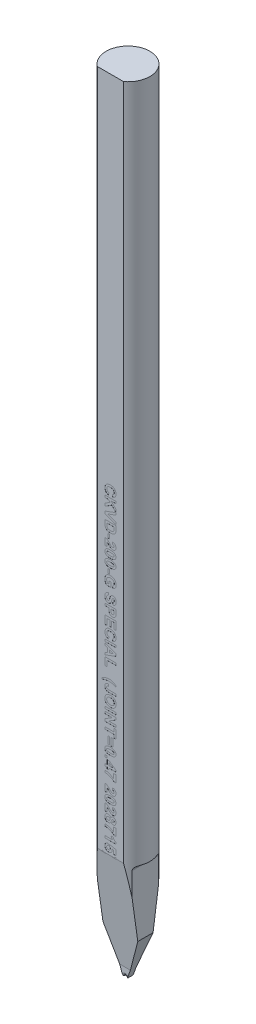
from build123d import *

# Parameters (mm, degrees)
SKETCH_TL_CUTTING_R       = 1.99771
TL_CUTTING_DEPTH          = 72.009
SKETCH_TDF_GRINDING_W     = 4.01542
SKETCH_TDF_GRINDING_H     = 4.01542
TDF_GRINDING_DEPTH        = 73.064400167
SKETCH_ENGRAVING_W        = 0.166666667
SKETCH_ENGRAVING_H        = 0.371794872
SKETCH_ENGRAVING_W_2      = 1
SKETCH_ENGRAVING_H_2      = 0.192307693
SKETCH_ENGRAVING_H_3      = 0.192307692
SKETCH_ENGRAVING_H_4      = 0.692307693
SKETCH_ENGRAVING_W_3      = 0.192307692
ENGRAVING_DEPTH           = 0.005
VW_VR_GRINDING_DEPTH      = 2.00771
VW_VR_GRINDING_DEPTH_BACK = 2.00771
ISA_GRINDING_DEPTH        = 2.00771
ISA_GRINDING_DEPTH_BACK   = 2.00771
PRE_FRX_BRX_DEPTH         = 2.00771
PRE_FRX_BRX_DEPTH_BACK    = 2.00771
SKETCH_PRE_FRX_BRX_W      = 1.7372
SKETCH_PRE_FRX_BRX_H      = 0.78994
FR_EDM_R                  = 0.20066
BR_EDM_R                  = 0.09906
FA_BA_GRINDING_DEPTH      = 2.00771
FA_BA_GRINDING_DEPTH_BACK = 2.00771


with BuildPart() as part:
    # sketch_TL_cutting → TL_cutting (new body)
    with BuildSketch(Plane(origin=(0, 0, 0), x_dir=(1, 0, 0), z_dir=(0, 1, 0))):
        Circle(SKETCH_TL_CUTTING_R)
    extrude(amount=TL_CUTTING_DEPTH)

    # sketch_TDF_grinding → TDF_grinding (cut, through all)
    with BuildSketch(Plane(origin=(0, 0, 0), x_dir=(1, 0, 0), z_dir=(0, 1, 0))):
        with Locations((0, -3.60918)):
            Rectangle(SKETCH_TDF_GRINDING_W, SKETCH_TDF_GRINDING_H)
    extrude(amount=TDF_GRINDING_DEPTH, mode=Mode.SUBTRACT)

    # sketch_engraving → engraving (cut)
    # profile 1 of 37: a face of its own
    with BuildSketch(Plane.XY.offset(1.60147)):
        with BuildLine():
            Line((-0.128205128, 38.861360256), (-0.192307692, 38.669052564))
            add(Edge.make_bspline(
                [(-0.192307692, 38.669052564), (-0.204917923, 38.672959052), (-0.229612721, 38.680609184), (-0.2649877, 38.694687804), (-0.297871332, 38.710682008), (-0.328259475, 38.728509875), (-0.356049464, 38.748245258), (-0.381471598, 38.769739244), (-0.404368127, 38.793203424), (-0.424673345, 38.818620624), (-0.442633936, 38.845713711), (-0.457816548, 38.874806053), (-0.470893242, 38.90546117), (-0.481488041, 38.937990557), (-0.489972889, 38.972178151), (-0.495577171, 39.008184413), (-0.499377062, 39.045840896), (-0.499789062, 39.071553283), (-0.5, 39.084717628)],
                knots=[0, 0, 0, 0, 1.126670901, 2.206376047, 3.246533763, 4.245677351, 5.210506282, 6.152793389, 7.083980095, 8.004497442, 8.926231833, 9.854395169, 10.801995143, 11.768203916, 12.771938831, 13.805609698, 14.87650608, 16, 16, 16, 16], degree=3))
            add(Edge.make_bspline(
                [(-0.5, 39.084717628), (-0.499663994, 39.100966309), (-0.499003061, 39.132927949), (-0.492350465, 39.179669052), (-0.481969511, 39.224210328), (-0.467601869, 39.266619613), (-0.448555271, 39.306598786), (-0.42571373, 39.344523108), (-0.398318662, 39.379959391), (-0.367249987, 39.413100716), (-0.332452821, 39.443229196), (-0.294134751, 39.469222297), (-0.253074131, 39.491760491), (-0.208709772, 39.509686594), (-0.161353037, 39.523771791), (-0.110975156, 39.533618328), (-0.057578507, 39.539784942), (-0.020984357, 39.540487083), (-0.002203526, 39.540847436)],
                knots=[0, 0, 0, 0, 1.025134988, 2.016471176, 2.973446247, 3.909197306, 4.836872559, 5.763618465, 6.698581235, 7.658772073, 8.627106982, 9.597494692, 10.576422683, 11.578339294, 12.6118974, 13.690673505, 14.814808564, 16, 16, 16, 16], degree=3))
            add(Edge.make_bspline(
                [(-0.002203526, 39.540847436), (0.017576475, 39.5404792), (0.056163648, 39.539760839), (0.112313555, 39.533712878), (0.165084042, 39.523666768), (0.214577853, 39.510090058), (0.260470573, 39.491879249), (0.303160692, 39.470023909), (0.342311169, 39.443906152), (0.377833814, 39.413981091), (0.409480853, 39.380847852), (0.437377469, 39.345143428), (0.460593243, 39.306641041), (0.479896446, 39.265817336), (0.494630503, 39.222373397), (0.505304611, 39.176426602), (0.511505561, 39.127956054), (0.512376199, 39.09481808), (0.512820513, 39.077906731)],
                knots=[0, 0, 0, 0, 1.212773307, 2.365899439, 3.458117515, 4.504331001, 5.50806732, 6.480562534, 7.440239902, 8.387651817, 9.323121479, 10.245404239, 11.160468186, 12.07454208, 13.009500751, 13.96802424, 14.963018902, 16, 16, 16, 16], degree=3))
            add(Edge.make_bspline(
                [(0.512820513, 39.077906731), (0.512448361, 39.063137276), (0.511718707, 39.034179796), (0.506761415, 38.991774506), (0.498061698, 38.951586158), (0.486319015, 38.913397521), (0.470821797, 38.877425987), (0.451884357, 38.843607111), (0.429606892, 38.811824651), (0.412205553, 38.792675065), (0.403445513, 38.783034936)],
                knots=[0, 0, 0, 0, 1.098510076, 2.153775193, 3.169777012, 4.153122333, 5.120892526, 6.076995459, 7.031936742, 8, 8, 8, 8], degree=3))
            add(Edge.make_bspline(
                [(0.403445513, 38.783034936), (0.39787141, 38.777447644), (0.386592274, 38.766141818), (0.367549896, 38.751045368), (0.347050772, 38.736732058), (0.324745215, 38.723429068), (0.30046466, 38.711556849), (0.274581981, 38.700544097), (0.246997406, 38.690405069), (0.227800247, 38.684766604), (0.217948718, 38.681873077)],
                knots=[0, 0, 0, 0, 0.885292881, 1.791380647, 2.722937556, 3.69093542, 4.703306561, 5.754477758, 6.847650944, 8, 8, 8, 8], degree=3))
            Line((0.217948718, 38.681873077), (0.179487179, 38.874180769))
            add(Edge.make_bspline(
                [(0.179487179, 38.874180769), (0.1857949, 38.875815288), (0.198219456, 38.879034861), (0.21607256, 38.88554955), (0.233014714, 38.893021208), (0.248625569, 38.9022861), (0.263619506, 38.912112074), (0.277222328, 38.923774773), (0.290109132, 38.936279754), (0.301694454, 38.950168861), (0.312145605, 38.965043589), (0.321339918, 38.980753983), (0.329014435, 38.997338478), (0.335156827, 39.014671754), (0.340319842, 39.032695702), (0.34350638, 39.051582147), (0.345953545, 39.071165752), (0.3460861, 39.084508875), (0.346153846, 39.091328205)],
                knots=[0, 0, 0, 0, 1.051114734, 2.070420253, 3.064047898, 4.034553068, 4.997066449, 5.953344811, 6.921213386, 7.892675544, 8.867420182, 9.852654213, 10.826683617, 11.811917648, 12.818610352, 13.848120519, 14.900229319, 16, 16, 16, 16], degree=3))
            add(Edge.make_bspline(
                [(0.346153846, 39.091328205), (0.345958725, 39.100692256), (0.345576529, 39.11903423), (0.341532101, 39.14576448), (0.335695112, 39.171205692), (0.326982094, 39.19526706), (0.315677399, 39.217881698), (0.302244603, 39.239378905), (0.286035184, 39.259210806), (0.26758257, 39.277849764), (0.246135655, 39.294557721), (0.221779967, 39.309260652), (0.194212535, 39.321454121), (0.163711493, 39.331354409), (0.130202077, 39.339146736), (0.093641969, 39.344711162), (0.054005962, 39.347788434), (0.026581025, 39.348283903), (0.012419872, 39.348539744)],
                knots=[0, 0, 0, 0, 0.93816214, 1.837638998, 2.704791736, 3.551915875, 4.396257554, 5.235807848, 6.087970119, 6.959042444, 7.860386085, 8.80649345, 9.804409709, 10.875695391, 12.017327537, 13.250155505, 14.580089023, 16, 16, 16, 16], degree=3))
            add(Edge.make_bspline(
                [(0.012419872, 39.348539744), (-0.002609028, 39.348286423), (-0.031567402, 39.347798312), (-0.073337178, 39.344721685), (-0.111754322, 39.339121705), (-0.14688701, 39.331432849), (-0.178713725, 39.321482973), (-0.207179389, 39.309309106), (-0.23231734, 39.294836701), (-0.254110839, 39.278088275), (-0.272831387, 39.259487256), (-0.288926796, 39.239537439), (-0.302688307, 39.218356524), (-0.314010391, 39.195817053), (-0.322575422, 39.171833298), (-0.328786932, 39.146602371), (-0.332735688, 39.120031695), (-0.333131326, 39.101825799), (-0.333333333, 39.092530128)],
                knots=[0, 0, 0, 0, 1.475208372, 2.842499301, 4.107722225, 5.282836115, 6.369007568, 7.375918121, 8.315702116, 9.208439171, 10.065831443, 10.90006451, 11.71996243, 12.54067204, 13.369972975, 14.214060185, 15.088124569, 16, 16, 16, 16], degree=3))
            add(Edge.make_bspline(
                [(-0.333333333, 39.092530128), (-0.333161634, 39.085647953), (-0.332824013, 39.072115176), (-0.330681155, 39.052112689), (-0.326591822, 39.03291438), (-0.321184418, 39.014426281), (-0.314399721, 38.996576559), (-0.305696319, 38.97963748), (-0.295693052, 38.963275777), (-0.283969989, 38.94783094), (-0.270808612, 38.933096156), (-0.255597341, 38.919657159), (-0.238701667, 38.907191373), (-0.220008678, 38.895856947), (-0.199678377, 38.88527516), (-0.177394008, 38.876272121), (-0.153515697, 38.867884984), (-0.136789345, 38.863573153), (-0.128205128, 38.861360256)],
                knots=[0, 0, 0, 0, 0.980177776, 1.927374078, 2.859849964, 3.771585772, 4.668674471, 5.574490016, 6.479656464, 7.396337719, 8.332153134, 9.288470092, 10.28125149, 11.318486971, 12.398724812, 13.541284404, 14.738150009, 16, 16, 16, 16], degree=3))
        make_face()
    # profile 2 of 37: a face of its own
    with BuildSketch(Plane.XY.offset(1.60147)):
        Polygon((-0.5, 38.502385897), (0.5, 38.502385897), (0.5, 38.310078205), (0.052283654, 38.310078205), (0.5, 37.888403526), (0.5, 37.624180769), (0.11338141, 38.003988462), (-0.5, 37.611360256), (-0.5, 37.867570192), (-0.035456731, 38.149821795), (-0.198517628, 38.310078205), (-0.5, 38.310078205), align=None)
    # profile 3 of 37: a face of its own
    with BuildSketch(Plane.XY.offset(1.60147)):
        Polygon((-0.5, 37.235158333), (0.5, 37.60495), (0.5, 37.401825), (-0.243589744, 37.137001282), (0.5, 36.873179167), (0.5, 36.669052564), (-0.5, 37.037441987), align=None)
    # profile 4 of 37: a face of its own
    with BuildSketch(Plane.XY.offset(1.60147)):
        with BuildLine():
            Line((0.5, 36.579308974), (0.5, 36.212522115))
            add(Edge.make_bspline(
                [(0.5, 36.212522115), (0.500005193, 36.202504571), (0.500015306, 36.182998084), (0.498840892, 36.154689066), (0.497659587, 36.128216494), (0.495294873, 36.103656352), (0.492816233, 36.080923432), (0.489678088, 36.059976942), (0.485656212, 36.040949202), (0.482484481, 36.028950319), (0.480969551, 36.023219231)],
                knots=[0, 0, 0, 0, 1.259756885, 2.453039283, 3.563158368, 4.591894114, 5.55549294, 6.43918076, 7.254497783, 8, 8, 8, 8], degree=3))
            add(Edge.make_bspline(
                [(0.480969551, 36.023219231), (0.478637325, 36.016050254), (0.474014881, 36.001841431), (0.465827813, 35.980988378), (0.455960096, 35.961154479), (0.445111978, 35.941879819), (0.432903728, 35.923607553), (0.419595761, 35.905892873), (0.404753223, 35.889259803), (0.383633179, 35.86772514), (0.35420815, 35.843300255), (0.315375005, 35.81746972), (0.272594656, 35.795732014), (0.234409605, 35.780540641), (0.20183843, 35.770496542), (0.175754603, 35.763928141), (0.148301213, 35.758256468), (0.119383738, 35.754006292), (0.08913491, 35.750344906), (0.057465542, 35.747717238), (0.024383276, 35.74641625), (0.001870575, 35.746124494), (-0.009615385, 35.745975641)],
                knots=[0, 0, 0, 0, 0.745431882, 1.477436776, 2.212739876, 2.934276521, 3.663147754, 4.384200836, 5.123377481, 5.865761747, 7.365547505, 8.894711587, 10.468722596, 12.101948761, 12.951987285, 13.837595333, 14.760899389, 15.722756883, 16.726861385, 17.773652936, 18.864119771, 20, 20, 20, 20], degree=3))
            add(Edge.make_bspline(
                [(-0.009615385, 35.745975641), (-0.0294616, 35.746367046), (-0.067834928, 35.74712384), (-0.123301552, 35.752721211), (-0.17465514, 35.762016648), (-0.206804138, 35.771727075), (-0.222355769, 35.776424359)],
                knots=[0, 0, 0, 0, 1.103491527, 2.133638164, 3.0971734, 4, 4, 4, 4], degree=3))
            add(Edge.make_bspline(
                [(-0.222355769, 35.776424359), (-0.231274521, 35.779598003), (-0.248819098, 35.785841057), (-0.274127236, 35.796765932), (-0.298211673, 35.808570337), (-0.321053432, 35.821352184), (-0.342549771, 35.835176052), (-0.362636394, 35.850093645), (-0.381577746, 35.865873731), (-0.393236239, 35.87730549), (-0.399038462, 35.882994872)],
                knots=[0, 0, 0, 0, 1.090884612, 2.145940218, 3.175104604, 4.181306866, 5.161203701, 6.118658341, 7.063689906, 8, 8, 8, 8], degree=3))
            add(Edge.make_bspline(
                [(-0.399038462, 35.882994872), (-0.407300305, 35.892281145), (-0.424264154, 35.911348431), (-0.445652736, 35.94469995), (-0.464086504, 35.982575276), (-0.473760833, 36.009889168), (-0.478766026, 36.024020513)],
                knots=[0, 0, 0, 0, 0.912008655, 1.872605891, 2.89935344, 4, 4, 4, 4], degree=3))
            add(Edge.make_bspline(
                [(-0.478766026, 36.024020513), (-0.4805228, 36.029740486), (-0.484168894, 36.041611996), (-0.488062998, 36.060435444), (-0.492165475, 36.080529947), (-0.49463687, 36.102127223), (-0.497243066, 36.125003081), (-0.498706299, 36.149339822), (-0.49974511, 36.175053081), (-0.499913777, 36.192689175), (-0.5, 36.201704808)],
                knots=[0, 0, 0, 0, 0.799129865, 1.658552685, 2.566799617, 3.538529252, 4.561352959, 5.643373779, 6.795284424, 8, 8, 8, 8], degree=3))
            Line((-0.5, 36.201704808), (-0.5, 36.579308974))
            Line((-0.5, 36.579308974), (0.5, 36.579308974))
        make_face()
        with BuildLine():
            Line((0.333333333, 36.387001282), (-0.333333333, 36.387001282))
            Line((-0.333333333, 36.387001282), (-0.333333333, 36.228748077))
            add(Edge.make_bspline(
                [(-0.333333333, 36.228748077), (-0.333276671, 36.22160336), (-0.333167574, 36.207847049), (-0.332847006, 36.187941316), (-0.331979167, 36.169648115), (-0.331080228, 36.152871614), (-0.329595022, 36.13765549), (-0.328134266, 36.123933535), (-0.326090699, 36.111782132), (-0.324477534, 36.104277127), (-0.323717949, 36.100743269)],
                knots=[0, 0, 0, 0, 1.333384787, 2.567275092, 3.714769766, 4.750907381, 5.701951617, 6.567520054, 7.325492842, 8, 8, 8, 8], degree=3))
            add(Edge.make_bspline(
                [(-0.323717949, 36.100743269), (-0.321509316, 36.092466575), (-0.317207482, 36.076345757), (-0.307617456, 36.053710499), (-0.296048139, 36.033228507), (-0.282136533, 36.01455677), (-0.26455548, 35.99772967), (-0.242070693, 35.983365683), (-0.215254411, 35.970072192), (-0.189584523, 35.960968806), (-0.16665678, 35.954434413), (-0.147412959, 35.950011165), (-0.126593091, 35.946515591), (-0.104279343, 35.943508942), (-0.080500412, 35.941079499), (-0.055170426, 35.939567784), (-0.028320392, 35.938536029), (-0.009883527, 35.938369161), (-0.000400641, 35.938283333)],
                knots=[0, 0, 0, 0, 1.038686998, 2.023088296, 2.974059649, 3.888265163, 4.839857954, 5.909819677, 7.113156087, 8.466843969, 9.20827164, 10.006482943, 10.861893492, 11.769681931, 12.739021491, 13.762258324, 14.849031541, 16, 16, 16, 16], degree=3))
            add(Edge.make_bspline(
                [(-0.000400641, 35.938283333), (0.009082275, 35.9383685), (0.027452469, 35.938533485), (0.054102292, 35.939563664), (0.079033415, 35.941066863), (0.102276578, 35.943513691), (0.123864169, 35.946473456), (0.143813574, 35.950010891), (0.161996804, 35.954404423), (0.183589283, 35.960957511), (0.207947697, 35.970794996), (0.23429421, 35.984621199), (0.2571147, 36.000886402), (0.276689574, 36.019241558), (0.29287817, 36.040328569), (0.306422028, 36.063699371), (0.316938162, 36.089830279), (0.321416742, 36.108419318), (0.323717949, 36.117970833)],
                knots=[0, 0, 0, 0, 1.118059345, 2.165891593, 3.144157881, 4.062285166, 4.920717571, 5.712910489, 6.449981617, 7.12489426, 8.371943983, 9.541298068, 10.624898781, 11.666293176, 12.69306237, 13.747704633, 14.842713931, 16, 16, 16, 16], degree=3))
            add(Edge.make_bspline(
                [(0.323717949, 36.117970833), (0.324486218, 36.122105143), (0.326177652, 36.131207311), (0.328151987, 36.146311571), (0.329628909, 36.164098179), (0.331099472, 36.184527116), (0.331977905, 36.207577064), (0.332859431, 36.233282571), (0.333166326, 36.261666851), (0.333276065, 36.281499207), (0.333333333, 36.291849038)],
                knots=[0, 0, 0, 0, 0.578739524, 1.274162912, 2.095457587, 3.035141998, 4.093102578, 5.270121571, 6.575369351, 8, 8, 8, 8], degree=3))
            Line((0.333333333, 36.291849038), (0.333333333, 36.387001282))
        make_face(mode=Mode.SUBTRACT)
    # profile 5 of 37: a face of its own
    with BuildSketch(Plane.XY.offset(1.60147)):
        with Locations((-0.147435898, 35.419052564)):
            Rectangle(SKETCH_ENGRAVING_W, SKETCH_ENGRAVING_H)
    # profile 6 of 37: a face of its own
    with BuildSketch(Plane.XY.offset(1.60147)):
        with BuildLine():
            Line((-0.307692308, 34.51520641), (-0.5, 34.51520641))
            Line((-0.5, 34.51520641), (-0.5, 35.169052564))
            add(Edge.make_bspline(
                [(-0.5, 35.169052564), (-0.483565984, 35.1668345), (-0.450707166, 35.162399615), (-0.402658764, 35.148772822), (-0.355879438, 35.130248094), (-0.317848438, 35.110342572), (-0.286923212, 35.09098663), (-0.262057708, 35.072774911), (-0.235074392, 35.051745206), (-0.206603976, 35.027194574), (-0.176093602, 34.999735521), (-0.14381225, 34.969026523), (-0.109876761, 34.934970728), (-0.086834533, 34.911009651), (-0.074919872, 34.898619872)],
                knots=[0, 0, 0, 0, 1.156381417, 2.312114436, 3.475445649, 4.663832578, 5.302694182, 6.020660876, 6.814180865, 7.69035705, 8.644181007, 9.679458435, 10.800095821, 12, 12, 12, 12], degree=3))
            add(Edge.make_bspline(
                [(-0.074919872, 34.898619872), (-0.065377972, 34.888730973), (-0.047213006, 34.869905421), (-0.021173696, 34.843126806), (0.002635387, 34.819519628), (0.024062885, 34.798947359), (0.042867348, 34.781136177), (0.059484162, 34.766564894), (0.073602098, 34.754779106), (0.082565079, 34.748402026), (0.086538462, 34.745575)],
                knots=[0, 0, 0, 0, 1.480739016, 2.818890974, 4.024686436, 5.093297083, 6.019761393, 6.815071481, 7.474708909, 8, 8, 8, 8], degree=3))
            add(Edge.make_bspline(
                [(0.086538462, 34.745575), (0.096145343, 34.739756108), (0.114654059, 34.728545371), (0.143960972, 34.716686299), (0.173010268, 34.708946232), (0.192528875, 34.707986075), (0.202123397, 34.707514103)],
                knots=[0, 0, 0, 0, 1.091434863, 2.102769638, 3.067401785, 4, 4, 4, 4], degree=3))
            add(Edge.make_bspline(
                [(0.202123397, 34.707514103), (0.212103794, 34.707867564), (0.230985925, 34.708536284), (0.257559137, 34.714329288), (0.280564781, 34.724157351), (0.299731306, 34.738170562), (0.314878913, 34.755819559), (0.325894297, 34.77657659), (0.332110851, 34.800514417), (0.33291372, 34.81732036), (0.333333333, 34.826103846)],
                knots=[0, 0, 0, 0, 1.192552326, 2.256215989, 3.232470907, 4.163657734, 5.069678789, 5.991331675, 6.950186205, 8, 8, 8, 8], degree=3))
            add(Edge.make_bspline(
                [(0.333333333, 34.826103846), (0.332938162, 34.834826083), (0.332174776, 34.851675562), (0.325505939, 34.875622328), (0.313961482, 34.896571328), (0.30080546, 34.9115007), (0.288012183, 34.921586199), (0.276863686, 34.928458106), (0.264195574, 34.934381153), (0.250150469, 34.939629467), (0.23456747, 34.943775042), (0.217565257, 34.94711363), (0.199052334, 34.94980405), (0.186173423, 34.950659651), (0.179487179, 34.951103846)],
                knots=[0, 0, 0, 0, 1.402788338, 2.709884207, 3.961032948, 5.225417836, 5.883680772, 6.578928686, 7.329201998, 8.132101139, 8.990263233, 9.922304639, 10.921339128, 12, 12, 12, 12], degree=3))
            Line((0.179487179, 34.951103846), (0.198317308, 35.143411538))
            add(Edge.make_bspline(
                [(0.198317308, 35.143411538), (0.211300501, 35.141865414), (0.236472838, 35.138867727), (0.272628993, 35.131386947), (0.305984679, 35.121912817), (0.336477992, 35.109993673), (0.364302841, 35.096122147), (0.389041697, 35.079590677), (0.410968596, 35.060976889), (0.430071868, 35.040264696), (0.446412285, 35.017585774), (0.460998615, 34.993788314), (0.472964043, 34.968407248), (0.482825353, 34.941722022), (0.490706433, 34.913744696), (0.495917297, 34.884345871), (0.499582638, 34.853706985), (0.499858783, 34.832792754), (0.5, 34.822097436)],
                knots=[0, 0, 0, 0, 1.270971563, 2.464210789, 3.586263665, 4.638946707, 5.643716971, 6.603612468, 7.52484387, 8.434700188, 9.336036235, 10.239171475, 11.145359471, 12.059630629, 13.003312604, 13.96741569, 14.960557767, 16, 16, 16, 16], degree=3))
            add(Edge.make_bspline(
                [(0.5, 34.822097436), (0.499776553, 34.810470228), (0.499341362, 34.787824782), (0.495746905, 34.754766703), (0.489481026, 34.723710072), (0.48117587, 34.694387686), (0.470106061, 34.667085423), (0.456633778, 34.641581801), (0.440545401, 34.618135967), (0.422288069, 34.596722647), (0.402418882, 34.57750341), (0.380890105, 34.561049126), (0.358545244, 34.546603325), (0.334632005, 34.535263401), (0.309750235, 34.526024415), (0.283460918, 34.5200797), (0.256153456, 34.515732639), (0.237464899, 34.51538376), (0.227964744, 34.51520641)],
                knots=[0, 0, 0, 0, 1.21054264, 2.357683783, 3.456743179, 4.506371233, 5.526380269, 6.518616322, 7.504105716, 8.480749833, 9.444588379, 10.376395364, 11.298423092, 12.209585683, 13.126776925, 14.056012185, 15.011791738, 16, 16, 16, 16], degree=3))
            add(Edge.make_bspline(
                [(0.227964744, 34.51520641), (0.217064496, 34.515451523), (0.195440077, 34.515937788), (0.163469012, 34.520578232), (0.132249846, 34.527702879), (0.101610438, 34.538110599), (0.071147148, 34.551782869), (0.040108962, 34.568520405), (0.008522341, 34.58879347), (-0.012178306, 34.604219216), (-0.022836538, 34.612161538)],
                knots=[0, 0, 0, 0, 0.953498, 1.891593709, 2.82157134, 3.753035249, 4.718494268, 5.740911752, 6.836853288, 8, 8, 8, 8], degree=3))
            add(Edge.make_bspline(
                [(-0.022836538, 34.612161538), (-0.026670091, 34.615200283), (-0.034880672, 34.621708569), (-0.047378398, 34.632814169), (-0.061345658, 34.645418652), (-0.076193638, 34.660099991), (-0.092563957, 34.67631898), (-0.109838998, 34.694505378), (-0.128325502, 34.714475449), (-0.147648705, 34.735426619), (-0.166391428, 34.756587623), (-0.184247543, 34.775933916), (-0.20029985, 34.793266722), (-0.214732899, 34.808418686), (-0.227268639, 34.821655936), (-0.238167377, 34.832725957), (-0.247265417, 34.841807085), (-0.26144337, 34.854323362), (-0.280620183, 34.870247881), (-0.298943771, 34.881451724), (-0.307692308, 34.886800962)],
                knots=[0, 0, 0, 0, 0.665546509, 1.425446362, 2.274432636, 3.225431318, 4.2662943, 5.410247296, 6.638261485, 7.969509561, 9.288545809, 10.484715594, 11.551975365, 12.503234464, 13.332293902, 14.032657109, 14.617374704, 15.080693821, 16.606187002, 18, 18, 18, 18], degree=3))
            Line((-0.307692308, 34.886800962), (-0.307692308, 34.51520641))
        make_face()
    # profile 7 of 37: a face of its own
    with BuildSketch(Plane.XY.offset(1.60147)):
        with BuildLine():
            add(Edge.make_bspline(
                [(0.5, 34.072898718), (0.49971384, 34.060994998), (0.499156721, 34.037819821), (0.494192381, 34.004057508), (0.486315205, 33.972304925), (0.474936732, 33.942555943), (0.460535804, 33.914659267), (0.442472771, 33.889007415), (0.421624591, 33.86500643), (0.405435577, 33.851150797), (0.397235577, 33.844132692)],
                knots=[0, 0, 0, 0, 1.098626248, 2.138899374, 3.143835643, 4.113754749, 5.073488057, 6.034745239, 7.004566348, 8, 8, 8, 8], degree=3))
            add(Edge.make_bspline(
                [(0.397235577, 33.844132692), (0.392013767, 33.840117993), (0.381356969, 33.831924695), (0.364136726, 33.82089029), (0.345869985, 33.810281685), (0.326116385, 33.801023442), (0.305221356, 33.792150078), (0.283126793, 33.783959313), (0.259707844, 33.77672695), (0.235071142, 33.770422124), (0.209179241, 33.764528627), (0.181968999, 33.759591398), (0.15350924, 33.755365972), (0.123831018, 33.752070738), (0.092992495, 33.749116339), (0.060842825, 33.747499757), (0.027454838, 33.746175267), (0.004742429, 33.746042949), (-0.006810897, 33.745975641)],
                knots=[0, 0, 0, 0, 0.746775751, 1.524038446, 2.317840886, 3.141016509, 3.996283186, 4.892488336, 5.812382473, 6.774967264, 7.776368117, 8.823659909, 9.910833035, 11.039122168, 12.210293276, 13.424012874, 14.68964937, 16, 16, 16, 16], degree=3))
            add(Edge.make_bspline(
                [(-0.006810897, 33.745975641), (-0.01836425, 33.746041934), (-0.041009977, 33.746171876), (-0.074330982, 33.747504693), (-0.106413621, 33.749117781), (-0.13725379, 33.752063853), (-0.166926114, 33.755390728), (-0.195353975, 33.759496272), (-0.22243919, 33.764814764), (-0.248289812, 33.770621418), (-0.27303117, 33.776886077), (-0.296407841, 33.7844399), (-0.318777777, 33.792300303), (-0.339699687, 33.801379898), (-0.359477735, 33.810970372), (-0.377930928, 33.821421112), (-0.395257891, 33.832578726), (-0.40597091, 33.840851289), (-0.411258013, 33.844933974)],
                knots=[0, 0, 0, 0, 1.308411734, 2.564617834, 3.776541518, 4.94597967, 6.0725993, 7.15816376, 8.197872509, 9.197791611, 10.158952087, 11.086962723, 11.979249638, 12.843171697, 13.668427753, 14.467630577, 15.243743175, 16, 16, 16, 16], degree=3))
            add(Edge.make_bspline(
                [(-0.411258013, 33.844933974), (-0.419387722, 33.851887875), (-0.435436162, 33.865615209), (-0.456111536, 33.889350465), (-0.473801555, 33.9149609), (-0.487914093, 33.942807064), (-0.499368982, 33.972411236), (-0.506993451, 34.004215546), (-0.511967929, 34.037885616), (-0.512532265, 34.061061213), (-0.512820513, 34.072898718)],
                knots=[0, 0, 0, 0, 0.991667276, 1.957599061, 2.911530233, 3.873218945, 4.847995157, 5.850445929, 6.902062539, 8, 8, 8, 8], degree=3))
            add(Edge.make_bspline(
                [(-0.512820513, 34.072898718), (-0.512476011, 34.084871133), (-0.511800941, 34.108331702), (-0.506449472, 34.142585149), (-0.497876451, 34.175144622), (-0.485636462, 34.205893234), (-0.469774335, 34.234786989), (-0.45076002, 34.262051616), (-0.427732542, 34.287093948), (-0.40629523, 34.306699361), (-0.386925042, 34.321042741), (-0.37086259, 34.331159036), (-0.353675124, 34.340935358), (-0.33482528, 34.349373499), (-0.314870578, 34.357698475), (-0.293380967, 34.365071787), (-0.270541238, 34.371576959), (-0.246455682, 34.377684901), (-0.220958398, 34.382778025), (-0.194124629, 34.387462952), (-0.165840258, 34.391154927), (-0.136262825, 34.394428243), (-0.105322509, 34.396732844), (-0.073069943, 34.398604475), (-0.039401887, 34.399542969), (-0.01649349, 34.399727608), (-0.004807692, 34.399821795)],
                knots=[0, 0, 0, 0, 1.257818097, 2.464759732, 3.634271214, 4.790227596, 5.933394726, 7.09190477, 8.274482889, 9.50191983, 10.139172818, 10.805000628, 11.49619854, 12.215266328, 12.973768034, 13.768328009, 14.601232062, 15.469317089, 16.379095881, 17.333267023, 18.331755967, 19.376479622, 20.460535752, 21.592206075, 22.771760786, 24, 24, 24, 24], degree=3))
            add(Edge.make_bspline(
                [(-0.004807692, 34.399821795), (0.006678925, 34.399756), (0.02919122, 34.399627052), (0.062378132, 34.398284948), (0.094328674, 34.396691634), (0.12509981, 34.39371902), (0.154640959, 34.390419515), (0.183004063, 34.386306894), (0.209982531, 34.380888814), (0.235876189, 34.375539743), (0.260431507, 34.368799782), (0.2837906, 34.361374475), (0.306110518, 34.353540136), (0.326924245, 34.344367854), (0.346659803, 34.334832898), (0.365109758, 34.324374838), (0.382437536, 34.313219066), (0.39315045, 34.304946265), (0.3984375, 34.300863462)],
                knots=[0, 0, 0, 0, 1.304443357, 2.556541329, 3.771813033, 4.936929721, 6.066661712, 7.147723817, 8.190304831, 9.191350322, 10.149780912, 11.080355239, 11.975107155, 12.834450748, 13.66198663, 14.463397305, 15.241653965, 16, 16, 16, 16], degree=3))
            add(Edge.make_bspline(
                [(0.3984375, 34.300863462), (0.406566428, 34.293909179), (0.422613323, 34.280181089), (0.443299998, 34.256451361), (0.460913987, 34.230869209), (0.475197493, 34.203104301), (0.486497465, 34.173432107), (0.494183265, 34.141586121), (0.499144648, 34.107910686), (0.499710816, 34.084735839), (0.5, 34.072898718)],
                knots=[0, 0, 0, 0, 0.991631672, 1.957528776, 2.911425699, 3.867574088, 4.848108326, 5.850523106, 6.902101959, 8, 8, 8, 8], degree=3))
        make_face()
        with BuildLine():
            add(Edge.make_bspline(
                [(0.333333333, 34.072898718), (0.333068079, 34.079066684), (0.332548986, 34.091137158), (0.328316127, 34.108692094), (0.321759633, 34.125273165), (0.312130705, 34.140831206), (0.299093083, 34.15523978), (0.281476094, 34.167447658), (0.259881539, 34.178001162), (0.243736, 34.183280771), (0.235176282, 34.186079808)],
                knots=[0, 0, 0, 0, 0.909107913, 1.77908945, 2.650019014, 3.530482969, 4.465025013, 5.495890128, 6.672421267, 8, 8, 8, 8], degree=3))
            add(Edge.make_bspline(
                [(0.235176282, 34.186079808), (0.228718042, 34.187827997), (0.214837576, 34.191585317), (0.192206647, 34.19584972), (0.166522939, 34.199366485), (0.137792419, 34.202336038), (0.105999886, 34.204752628), (0.071125109, 34.206240848), (0.033192525, 34.207269478), (0.006878451, 34.207430391), (-0.006810897, 34.207514103)],
                knots=[0, 0, 0, 0, 0.658986521, 1.416336438, 2.266694271, 3.212608458, 4.261595115, 5.407496572, 6.651304179, 8, 8, 8, 8], degree=3))
            add(Edge.make_bspline(
                [(-0.006810897, 34.207514103), (-0.020433943, 34.207523117), (-0.046549094, 34.207540397), (-0.084006477, 34.206366163), (-0.118154033, 34.20519872), (-0.148991056, 34.202829061), (-0.176626244, 34.200490892), (-0.200847568, 34.196953343), (-0.221857789, 34.193400608), (-0.244486895, 34.187367153), (-0.268257705, 34.179051394), (-0.292448985, 34.167822977), (-0.311537375, 34.155157058), (-0.325415776, 34.140625587), (-0.334597404, 34.124880329), (-0.341538269, 34.108576395), (-0.345246665, 34.091024555), (-0.345848983, 34.078990013), (-0.346153846, 34.072898718)],
                knots=[0, 0, 0, 0, 1.613038927, 3.092168624, 4.43749063, 5.658264602, 6.75425577, 7.720394221, 8.556328411, 9.275513998, 10.490872946, 11.534172084, 12.42681833, 13.187531851, 13.88996177, 14.574222125, 15.278341114, 16, 16, 16, 16], degree=3))
            add(Edge.make_bspline(
                [(-0.346153846, 34.072898718), (-0.345874419, 34.06680088), (-0.345321688, 34.054738799), (-0.341225408, 34.037206833), (-0.334465655, 34.020649336), (-0.325029126, 34.004986493), (-0.311901617, 33.99056441), (-0.294300445, 33.978347614), (-0.272700888, 33.96779693), (-0.25655611, 33.962516893), (-0.247996795, 33.959717628)],
                knots=[0, 0, 0, 0, 0.899391665, 1.779078861, 2.640979247, 3.529945348, 4.464599804, 5.495588918, 6.672261578, 8, 8, 8, 8], degree=3))
            add(Edge.make_bspline(
                [(-0.247996795, 33.959717628), (-0.241538043, 33.957971968), (-0.227719754, 33.954237186), (-0.205229709, 33.949942396), (-0.179679092, 33.94641611), (-0.151079269, 33.943474791), (-0.11935541, 33.941034431), (-0.084546407, 33.939558845), (-0.046680798, 33.938529247), (-0.020433482, 33.938367356), (-0.006810897, 33.938283333)],
                knots=[0, 0, 0, 0, 0.66114423, 1.414496391, 2.261103113, 3.210114492, 4.255954433, 5.405607896, 6.653488082, 8, 8, 8, 8], degree=3))
            add(Edge.make_bspline(
                [(-0.006810897, 33.938283333), (0.006810741, 33.938397109), (0.032921137, 33.938615199), (0.070464093, 33.939242091), (0.104645163, 33.940997006), (0.13553417, 33.942753226), (0.163028833, 33.945718631), (0.187277888, 33.948661537), (0.208178651, 33.952733667), (0.23096624, 33.958325697), (0.254848985, 33.96666368), (0.278913284, 33.97823584), (0.298191428, 33.99067291), (0.312146257, 34.005179879), (0.321683592, 34.020898044), (0.328364426, 34.037350374), (0.332523972, 34.054799531), (0.333060584, 34.06679941), (0.333333333, 34.072898718)],
                knots=[0, 0, 0, 0, 1.611458614, 3.088895909, 4.441089836, 5.660086535, 6.747875232, 7.711965119, 8.548505902, 9.26500436, 10.486583113, 11.532259092, 12.419544583, 13.184925779, 13.890764661, 14.581638641, 15.279074115, 16, 16, 16, 16], degree=3))
        make_face(mode=Mode.SUBTRACT)
    # profile 8 of 37: a face of its own
    with BuildSketch(Plane.XY.offset(1.60147)):
        with BuildLine():
            add(Edge.make_bspline(
                [(0.5, 33.303667949), (0.49971384, 33.291764229), (0.499156721, 33.268589051), (0.494192381, 33.234826739), (0.486315205, 33.203074156), (0.474936732, 33.173325173), (0.460535804, 33.145428497), (0.442472771, 33.119776646), (0.421624591, 33.095775661), (0.405435577, 33.081920028), (0.397235577, 33.074901923)],
                knots=[0, 0, 0, 0, 1.098626248, 2.138899374, 3.143835643, 4.113754749, 5.073488057, 6.034745239, 7.004566348, 8, 8, 8, 8], degree=3))
            add(Edge.make_bspline(
                [(0.397235577, 33.074901923), (0.392013767, 33.070887224), (0.381356969, 33.062693926), (0.364136726, 33.05165952), (0.345869985, 33.041050915), (0.326116385, 33.031792673), (0.305221356, 33.022919309), (0.283126793, 33.014728544), (0.259707844, 33.00749618), (0.235071142, 33.001191354), (0.209179241, 32.995297858), (0.181968999, 32.990360628), (0.15350924, 32.986135203), (0.123831018, 32.982839969), (0.092992495, 32.97988557), (0.060842825, 32.978268988), (0.027454838, 32.976944498), (0.004742429, 32.976812179), (-0.006810897, 32.976744872)],
                knots=[0, 0, 0, 0, 0.746775751, 1.524038446, 2.317840886, 3.141016509, 3.996283186, 4.892488336, 5.812382473, 6.774967264, 7.776368117, 8.823659909, 9.910833035, 11.039122168, 12.210293276, 13.424012874, 14.68964937, 16, 16, 16, 16], degree=3))
            add(Edge.make_bspline(
                [(-0.006810897, 32.976744872), (-0.01836425, 32.976811165), (-0.041009977, 32.976941107), (-0.074330982, 32.978273924), (-0.106413621, 32.979887012), (-0.13725379, 32.982833084), (-0.166926114, 32.986159959), (-0.195353975, 32.990265503), (-0.22243919, 32.995583995), (-0.248289812, 33.001390649), (-0.27303117, 33.007655308), (-0.296407841, 33.015209131), (-0.318777777, 33.023069533), (-0.339699687, 33.032149129), (-0.359477735, 33.041739602), (-0.377930928, 33.052190342), (-0.395257891, 33.063347957), (-0.40597091, 33.07162052), (-0.411258013, 33.075703205)],
                knots=[0, 0, 0, 0, 1.308411734, 2.564617834, 3.776541518, 4.94597967, 6.0725993, 7.15816376, 8.197872509, 9.197791611, 10.158952087, 11.086962723, 11.979249638, 12.843171697, 13.668427753, 14.467630577, 15.243743175, 16, 16, 16, 16], degree=3))
            add(Edge.make_bspline(
                [(-0.411258013, 33.075703205), (-0.419387722, 33.082657105), (-0.435436162, 33.09638444), (-0.456111536, 33.120119695), (-0.473801555, 33.145730131), (-0.487914093, 33.173576295), (-0.499368982, 33.203180467), (-0.506993451, 33.234984777), (-0.511967929, 33.268654847), (-0.512532265, 33.291830444), (-0.512820513, 33.303667949)],
                knots=[0, 0, 0, 0, 0.991667276, 1.957599061, 2.911530233, 3.873218945, 4.847995157, 5.850445929, 6.902062539, 8, 8, 8, 8], degree=3))
            add(Edge.make_bspline(
                [(-0.512820513, 33.303667949), (-0.512476011, 33.315640364), (-0.511800941, 33.339100933), (-0.506449472, 33.373354379), (-0.497876451, 33.405913853), (-0.485636462, 33.436662465), (-0.469774335, 33.46555622), (-0.45076002, 33.492820847), (-0.427732542, 33.517863179), (-0.40629523, 33.537468592), (-0.386925042, 33.551811971), (-0.37086259, 33.561928267), (-0.353675124, 33.571704589), (-0.33482528, 33.58014273), (-0.314870578, 33.588467706), (-0.293380967, 33.595841018), (-0.270541238, 33.60234619), (-0.246455682, 33.608454132), (-0.220958398, 33.613547256), (-0.194124629, 33.618232183), (-0.165840258, 33.621924157), (-0.136262825, 33.625197473), (-0.105322509, 33.627502075), (-0.073069943, 33.629373706), (-0.039401887, 33.6303122), (-0.01649349, 33.630496839), (-0.004807692, 33.630591026)],
                knots=[0, 0, 0, 0, 1.257818097, 2.464759732, 3.634271214, 4.790227596, 5.933394726, 7.09190477, 8.274482889, 9.50191983, 10.139172818, 10.805000628, 11.49619854, 12.215266328, 12.973768034, 13.768328009, 14.601232062, 15.469317089, 16.379095881, 17.333267023, 18.331755967, 19.376479622, 20.460535752, 21.592206075, 22.771760786, 24, 24, 24, 24], degree=3))
            add(Edge.make_bspline(
                [(-0.004807692, 33.630591026), (0.006678925, 33.630525231), (0.02919122, 33.630396282), (0.062378132, 33.629054179), (0.094328674, 33.627460865), (0.12509981, 33.624488251), (0.154640959, 33.621188746), (0.183004063, 33.617076125), (0.209982531, 33.611658045), (0.235876189, 33.606308974), (0.260431507, 33.599569013), (0.2837906, 33.592143706), (0.306110518, 33.584309367), (0.326924245, 33.575137084), (0.346659803, 33.565602128), (0.365109758, 33.555144069), (0.382437536, 33.543988297), (0.39315045, 33.535715495), (0.3984375, 33.531632692)],
                knots=[0, 0, 0, 0, 1.304443357, 2.556541329, 3.771813033, 4.936929721, 6.066661712, 7.147723817, 8.190304831, 9.191350322, 10.149780912, 11.080355239, 11.975107155, 12.834450748, 13.66198663, 14.463397305, 15.241653965, 16, 16, 16, 16], degree=3))
            add(Edge.make_bspline(
                [(0.3984375, 33.531632692), (0.406566428, 33.52467841), (0.422613323, 33.51095032), (0.443299998, 33.487220592), (0.460913987, 33.461638439), (0.475197493, 33.433873532), (0.486497465, 33.404201338), (0.494183265, 33.372355352), (0.499144648, 33.338679916), (0.499710816, 33.31550507), (0.5, 33.303667949)],
                knots=[0, 0, 0, 0, 0.991631672, 1.957528776, 2.911425699, 3.867574088, 4.848108326, 5.850523106, 6.902101959, 8, 8, 8, 8], degree=3))
        make_face()
        with BuildLine():
            add(Edge.make_bspline(
                [(0.333333333, 33.303667949), (0.333068079, 33.309835915), (0.332548986, 33.321906389), (0.328316127, 33.339461325), (0.321759633, 33.356042396), (0.312130705, 33.371600436), (0.299093083, 33.386009011), (0.281476094, 33.398216888), (0.259881539, 33.408770392), (0.243736, 33.414050001), (0.235176282, 33.416849038)],
                knots=[0, 0, 0, 0, 0.909107913, 1.77908945, 2.650019014, 3.530482969, 4.465025013, 5.495890128, 6.672421267, 8, 8, 8, 8], degree=3))
            add(Edge.make_bspline(
                [(0.235176282, 33.416849038), (0.228718042, 33.418597227), (0.214837576, 33.422354548), (0.192206647, 33.426618951), (0.166522939, 33.430135716), (0.137792419, 33.433105269), (0.105999886, 33.435521859), (0.071125109, 33.437010078), (0.033192525, 33.438038709), (0.006878451, 33.438199622), (-0.006810897, 33.438283333)],
                knots=[0, 0, 0, 0, 0.658986521, 1.416336438, 2.266694271, 3.212608458, 4.261595115, 5.407496572, 6.651304179, 8, 8, 8, 8], degree=3))
            add(Edge.make_bspline(
                [(-0.006810897, 33.438283333), (-0.020433943, 33.438292347), (-0.046549094, 33.438309627), (-0.084006477, 33.437135394), (-0.118154033, 33.435967951), (-0.148991056, 33.433598292), (-0.176626244, 33.431260123), (-0.200847568, 33.427722574), (-0.221857789, 33.424169839), (-0.244486895, 33.418136384), (-0.268257705, 33.409820625), (-0.292448985, 33.398592207), (-0.311537375, 33.385926289), (-0.325415776, 33.371394818), (-0.334597404, 33.35564956), (-0.341538269, 33.339345625), (-0.345246665, 33.321793786), (-0.345848983, 33.309759244), (-0.346153846, 33.303667949)],
                knots=[0, 0, 0, 0, 1.613038927, 3.092168624, 4.43749063, 5.658264602, 6.75425577, 7.720394221, 8.556328411, 9.275513998, 10.490872946, 11.534172084, 12.42681833, 13.187531851, 13.88996177, 14.574222125, 15.278341114, 16, 16, 16, 16], degree=3))
            add(Edge.make_bspline(
                [(-0.346153846, 33.303667949), (-0.345874419, 33.297570111), (-0.345321688, 33.28550803), (-0.341225408, 33.267976063), (-0.334465655, 33.251418567), (-0.325029126, 33.235755723), (-0.311901617, 33.221333641), (-0.294300445, 33.209116845), (-0.272700888, 33.198566161), (-0.25655611, 33.193286123), (-0.247996795, 33.190486859)],
                knots=[0, 0, 0, 0, 0.899391665, 1.779078861, 2.640979247, 3.529945348, 4.464599804, 5.495588918, 6.672261578, 8, 8, 8, 8], degree=3))
            add(Edge.make_bspline(
                [(-0.247996795, 33.190486859), (-0.241538043, 33.188741199), (-0.227719754, 33.185006417), (-0.205229709, 33.180711627), (-0.179679092, 33.17718534), (-0.151079269, 33.174244022), (-0.11935541, 33.171803662), (-0.084546407, 33.170328076), (-0.046680798, 33.169298478), (-0.020433482, 33.169136587), (-0.006810897, 33.169052564)],
                knots=[0, 0, 0, 0, 0.66114423, 1.414496391, 2.261103113, 3.210114492, 4.255954433, 5.405607896, 6.653488082, 8, 8, 8, 8], degree=3))
            add(Edge.make_bspline(
                [(-0.006810897, 33.169052564), (0.006810741, 33.16916634), (0.032921137, 33.16938443), (0.070464093, 33.170011322), (0.104645163, 33.171766237), (0.13553417, 33.173522457), (0.163028833, 33.176487861), (0.187277888, 33.179430768), (0.208178651, 33.183502897), (0.23096624, 33.189094928), (0.254848985, 33.19743291), (0.278913284, 33.209005071), (0.298191428, 33.221442141), (0.312146257, 33.23594911), (0.321683592, 33.251667274), (0.328364426, 33.268119605), (0.332523972, 33.285568762), (0.333060584, 33.297568641), (0.333333333, 33.303667949)],
                knots=[0, 0, 0, 0, 1.611458614, 3.088895909, 4.441089836, 5.660086535, 6.747875232, 7.711965119, 8.548505902, 9.26500436, 10.486583113, 11.532259092, 12.419544583, 13.184925779, 13.890764661, 14.581638641, 15.279074115, 16, 16, 16, 16], degree=3))
        make_face(mode=Mode.SUBTRACT)
    # profile 9 of 37: a face of its own
    with BuildSketch(Plane.XY.offset(1.60147)):
        with Locations((-0.147435898, 32.649821795)):
            Rectangle(SKETCH_ENGRAVING_W, SKETCH_ENGRAVING_H)
    # profile 10 of 37: a face of its own
    with BuildSketch(Plane.XY.offset(1.60147)):
        with BuildLine():
            Line((-0.128205128, 31.899821795), (0.038461538, 31.899821795))
            Line((0.038461538, 31.899821795), (0.038461538, 31.463924359))
            Line((0.038461538, 31.463924359), (-0.36338141, 31.463924359))
            add(Edge.make_bspline(
                [(-0.36338141, 31.463924359), (-0.368321434, 31.469410375), (-0.378419843, 31.4806249), (-0.392661125, 31.498922664), (-0.406257259, 31.519066779), (-0.4194836, 31.540935469), (-0.432233696, 31.564573992), (-0.444685123, 31.589888064), (-0.45671611, 31.616924391), (-0.471787381, 31.655157711), (-0.488186169, 31.70437183), (-0.502445448, 31.764537076), (-0.511191227, 31.825178267), (-0.512277771, 31.865739075), (-0.512820513, 31.885999679)],
                knots=[0, 0, 0, 0, 0.581799769, 1.189316438, 1.825828404, 2.496525428, 3.203088405, 3.942228803, 4.719818701, 5.534979611, 7.181138583, 8.803804008, 10.403462225, 12, 12, 12, 12], degree=3))
            add(Edge.make_bspline(
                [(-0.512820513, 31.885999679), (-0.512629241, 31.898692166), (-0.512252188, 31.923712831), (-0.509233571, 31.960651118), (-0.504017902, 31.996368224), (-0.496780719, 32.030800736), (-0.487836372, 32.064051646), (-0.476607913, 32.096004166), (-0.463065488, 32.126624068), (-0.447986133, 32.156140581), (-0.430657849, 32.183993177), (-0.411724289, 32.210237023), (-0.390891397, 32.234617404), (-0.36853351, 32.257346217), (-0.344060025, 32.277994803), (-0.318106216, 32.297076641), (-0.290219674, 32.314135038), (-0.260879177, 32.329461559), (-0.230317098, 32.343090942), (-0.198781008, 32.354593246), (-0.166726875, 32.364676922), (-0.134042675, 32.372964707), (-0.10062201, 32.379051654), (-0.066619552, 32.383783529), (-0.031822841, 32.386325004), (-0.008417054, 32.386774325), (0.003405449, 32.387001282)],
                knots=[0, 0, 0, 0, 1.124897971, 2.217508473, 3.282174662, 4.322209414, 5.334422951, 6.332119154, 7.320662553, 8.300074908, 9.267468154, 10.225199689, 11.165658754, 12.107290334, 13.047749399, 14.00069605, 14.959944213, 15.942088746, 16.933021067, 17.923599838, 18.915715637, 19.910475908, 20.909926025, 21.925232038, 22.952013513, 24, 24, 24, 24], degree=3))
            add(Edge.make_bspline(
                [(0.003405449, 32.387001282), (0.016165747, 32.386817383), (0.041321811, 32.386454838), (0.078501182, 32.383325194), (0.114594914, 32.378477239), (0.149519517, 32.371082247), (0.183523729, 32.362228796), (0.216299841, 32.350884109), (0.248180515, 32.337930661), (0.278688999, 32.322646543), (0.308028284, 32.305763971), (0.335510174, 32.2865804), (0.361403632, 32.2657608), (0.385591047, 32.243117968), (0.407627145, 32.218279007), (0.428063784, 32.191753308), (0.447146094, 32.16355846), (0.457908016, 32.143381736), (0.463341346, 32.133195192)],
                knots=[0, 0, 0, 0, 1.105132952, 2.178694671, 3.229818344, 4.257558797, 5.269123684, 6.27148554, 7.259679084, 8.247804916, 9.224967877, 10.189258471, 11.147685264, 12.101072275, 13.055511435, 14.02039165, 15.000562851, 16, 16, 16, 16], degree=3))
            add(Edge.make_bspline(
                [(0.463341346, 32.133195192), (0.467347168, 32.125107841), (0.475455657, 32.108737618), (0.485329628, 32.082664525), (0.494054347, 32.055296948), (0.500719187, 32.026315473), (0.506115234, 31.996028993), (0.510216979, 31.964287917), (0.512307439, 31.931033708), (0.512647258, 31.908371284), (0.512820513, 31.896816987)],
                knots=[0, 0, 0, 0, 0.887950456, 1.797368171, 2.741221183, 3.713797788, 4.722103116, 5.768966405, 6.862521341, 8, 8, 8, 8], degree=3))
            add(Edge.make_bspline(
                [(0.512820513, 31.896816987), (0.512598613, 31.881919487), (0.512167059, 31.852946604), (0.508571106, 31.81070631), (0.502373597, 31.770952674), (0.493837942, 31.733630334), (0.482863355, 31.698819697), (0.469371425, 31.666580687), (0.453633675, 31.636715429), (0.435019378, 31.609656485), (0.414494937, 31.584853918), (0.392035387, 31.562372449), (0.367607461, 31.542203031), (0.341334074, 31.524332318), (0.313106625, 31.508900967), (0.283182558, 31.495632952), (0.251334696, 31.484711769), (0.22921692, 31.479433803), (0.217948718, 31.476744872)],
                knots=[0, 0, 0, 0, 1.271135529, 2.472123572, 3.614091059, 4.701890498, 5.736279567, 6.724681829, 7.680621489, 8.611506429, 9.52200816, 10.424540711, 11.318996785, 12.221421405, 13.131851814, 14.060431888, 15.011860567, 16, 16, 16, 16], degree=3))
            Line((0.217948718, 31.476744872), (0.179487179, 31.669052564))
            add(Edge.make_bspline(
                [(0.179487179, 31.669052564), (0.185798707, 31.670955146), (0.198251232, 31.674708905), (0.216108293, 31.682015481), (0.232994438, 31.690333603), (0.248643132, 31.700160597), (0.263649233, 31.710598251), (0.277161531, 31.722868435), (0.290187329, 31.735775453), (0.301701762, 31.750266609), (0.312086782, 31.765705164), (0.321450083, 31.781926632), (0.329043783, 31.799294974), (0.335153652, 31.817567597), (0.340342569, 31.836655002), (0.343533767, 31.85680634), (0.345940549, 31.8777953), (0.346081986, 31.892135325), (0.346153846, 31.899421154)],
                knots=[0, 0, 0, 0, 1.027780279, 2.027791312, 3.006028774, 3.96000864, 4.908113241, 5.852721087, 6.802883308, 7.765918715, 8.733730415, 9.704005314, 10.683351261, 11.68471758, 12.707948499, 13.764514378, 14.864202456, 16, 16, 16, 16], degree=3))
            add(Edge.make_bspline(
                [(0.346153846, 31.899421154), (0.345859633, 31.910448511), (0.34528545, 31.931969337), (0.341538784, 31.963386876), (0.334873123, 31.993026442), (0.325679114, 32.02096554), (0.313877959, 32.047255391), (0.299029501, 32.071540737), (0.282012344, 32.09442627), (0.262039987, 32.115260747), (0.239645267, 32.13415525), (0.214561065, 32.150511822), (0.186868462, 32.164128599), (0.156706511, 32.175281515), (0.124073954, 32.184161616), (0.088855272, 32.190185764), (0.051104495, 32.194121833), (0.02505068, 32.194499093), (0.01161859, 32.19469359)],
                knots=[0, 0, 0, 0, 1.043810997, 2.037086103, 2.989314757, 3.91471467, 4.817033861, 5.710208705, 6.603920097, 7.511448416, 8.435617211, 9.371747005, 10.338444094, 11.350425613, 12.411431869, 13.5347293, 14.729025275, 16, 16, 16, 16], degree=3))
            add(Edge.make_bspline(
                [(0.01161859, 32.19469359), (-0.002813331, 32.194490916), (-0.03086261, 32.194097007), (-0.071503034, 32.190262106), (-0.109371212, 32.183963885), (-0.14440027, 32.174896527), (-0.176807311, 32.163589264), (-0.206438048, 32.149609735), (-0.233109204, 32.132801899), (-0.256980675, 32.113739064), (-0.278169336, 32.092702253), (-0.296147735, 32.069639293), (-0.31184176, 32.045381086), (-0.32420794, 32.019241286), (-0.33413508, 31.991692798), (-0.341078682, 31.962466769), (-0.345395871, 31.931668498), (-0.345897627, 31.910586945), (-0.346153846, 31.899821795)],
                knots=[0, 0, 0, 0, 1.31821493, 2.562027667, 3.72541598, 4.821825939, 5.863743127, 6.857000185, 7.808227391, 8.737146514, 9.643023621, 10.529087527, 11.404035307, 12.277173472, 13.164790074, 14.074766194, 15.016892606, 16, 16, 16, 16], degree=3))
            add(Edge.make_bspline(
                [(-0.346153846, 31.899821795), (-0.345850315, 31.888918504), (-0.34524035, 31.867007617), (-0.340086045, 31.834186537), (-0.332449955, 31.801186283), (-0.321065283, 31.768793933), (-0.307937779, 31.737407225), (-0.292687307, 31.708241024), (-0.276962331, 31.680848447), (-0.264654274, 31.664335969), (-0.258613782, 31.656232051)],
                knots=[0, 0, 0, 0, 0.993779204, 1.997065276, 3.023588959, 4.078879359, 5.123947549, 6.123456565, 7.079038607, 8, 8, 8, 8], degree=3))
            Line((-0.258613782, 31.656232051), (-0.128205128, 31.656232051))
            Line((-0.128205128, 31.656232051), (-0.128205128, 31.899821795))
        make_face()
    # profile 11 of 37: a face of its own
    with BuildSketch(Plane.XY.offset(1.60147)):
        with BuildLine():
            Line((-0.166666667, 30.938283333), (-0.153846154, 30.745975641))
            add(Edge.make_bspline(
                [(-0.153846154, 30.745975641), (-0.161891279, 30.744442992), (-0.177518424, 30.741465918), (-0.199795017, 30.734862009), (-0.220541784, 30.727555841), (-0.239662803, 30.718942964), (-0.25710555, 30.709077896), (-0.273156714, 30.698287618), (-0.28732832, 30.686044862), (-0.299925293, 30.672713176), (-0.310783278, 30.658139999), (-0.320246275, 30.642439399), (-0.328256178, 30.625518131), (-0.334922245, 30.607440819), (-0.339885492, 30.588027406), (-0.343420115, 30.567459762), (-0.345682646, 30.545704761), (-0.345994208, 30.530837096), (-0.346153846, 30.523219231)],
                knots=[0, 0, 0, 0, 1.20477517, 2.340199137, 3.415898527, 4.440826703, 5.422227366, 6.362763262, 7.28278988, 8.172822029, 9.057410505, 9.952475558, 10.866920142, 11.809098, 12.784128911, 13.811833846, 14.878831738, 16, 16, 16, 16], degree=3))
            add(Edge.make_bspline(
                [(-0.346153846, 30.523219231), (-0.346066367, 30.515200933), (-0.345896216, 30.499604929), (-0.343785338, 30.477004596), (-0.340761278, 30.455872259), (-0.335974263, 30.436394522), (-0.330620744, 30.418207658), (-0.323296559, 30.401763353), (-0.314849171, 30.386795499), (-0.305263574, 30.373342657), (-0.294632459, 30.361602348), (-0.28353392, 30.351331341), (-0.272207737, 30.342385972), (-0.260151301, 30.335345334), (-0.247852227, 30.329647439), (-0.234943611, 30.32588153), (-0.221721863, 30.323337435), (-0.212685699, 30.323045702), (-0.208133013, 30.322898718)],
                knots=[0, 0, 0, 0, 1.417779877, 2.757654889, 4.012140507, 5.189587551, 6.302846416, 7.360586765, 8.365575446, 9.33904572, 10.275781718, 11.161696098, 12.012180333, 12.822428111, 13.625933072, 14.403138519, 15.195454004, 16, 16, 16, 16], degree=3))
            add(Edge.make_bspline(
                [(-0.208133013, 30.322898718), (-0.202439146, 30.323192996), (-0.191320796, 30.323767629), (-0.175220679, 30.327537928), (-0.160658688, 30.334342431), (-0.147071392, 30.343578971), (-0.134926522, 30.356543369), (-0.123459543, 30.372947524), (-0.11316916, 30.393407237), (-0.107424402, 30.408575842), (-0.104366987, 30.416648718)],
                knots=[0, 0, 0, 0, 0.906150226, 1.7694295, 2.610923838, 3.450874087, 4.367551936, 5.419872502, 6.626831617, 8, 8, 8, 8], degree=3))
            add(Edge.make_bspline(
                [(-0.104366987, 30.416648718), (-0.103205903, 30.420112905), (-0.100607587, 30.427865194), (-0.096897182, 30.441091154), (-0.092218385, 30.457076556), (-0.087052561, 30.475969979), (-0.081545375, 30.497732885), (-0.074955523, 30.522158532), (-0.068334023, 30.549617832), (-0.063456004, 30.568830895), (-0.060897436, 30.578908333)],
                knots=[0, 0, 0, 0, 0.521824192, 1.167757792, 1.961731518, 2.901193269, 3.965386864, 5.168422915, 6.514810244, 8, 8, 8, 8], degree=3))
            add(Edge.make_bspline(
                [(-0.060897436, 30.578908333), (-0.0576208, 30.592031849), (-0.051299067, 30.617351528), (-0.040053153, 30.653463187), (-0.028879714, 30.686722685), (-0.016755933, 30.716809788), (-0.004503472, 30.744056368), (0.008737874, 30.768021704), (0.022280434, 30.7892059), (0.032402475, 30.801550422), (0.037259615, 30.807474038)],
                knots=[0, 0, 0, 0, 1.293880989, 2.496331788, 3.617634808, 4.64976062, 5.598842568, 6.473791081, 7.267636666, 8, 8, 8, 8], degree=3))
            add(Edge.make_bspline(
                [(0.037259615, 30.807474038), (0.044137694, 30.814820092), (0.057622804, 30.829222711), (0.079781426, 30.848181522), (0.103188466, 30.864112086), (0.127671148, 30.877224684), (0.153370416, 30.887321137), (0.180114252, 30.894477373), (0.207972454, 30.899109148), (0.22694455, 30.899581789), (0.236578526, 30.899821795)],
                knots=[0, 0, 0, 0, 1.064429417, 2.086912298, 3.078678339, 4.055528992, 5.020032834, 5.993708893, 6.981211098, 8, 8, 8, 8], degree=3))
            add(Edge.make_bspline(
                [(0.236578526, 30.899821795), (0.249044725, 30.899354331), (0.273773943, 30.898427024), (0.310123415, 30.88992467), (0.34519423, 30.87667628), (0.373053378, 30.861323891), (0.394102454, 30.846545366), (0.409316468, 30.834318713), (0.423234984, 30.820628899), (0.436363342, 30.805967469), (0.448421192, 30.790088333), (0.459337354, 30.772971959), (0.469762031, 30.754940204), (0.481724432, 30.728627828), (0.494501972, 30.693096959), (0.505216674, 30.646861911), (0.511620444, 30.596516137), (0.512410831, 30.561566875), (0.512820513, 30.543451603)],
                knots=[0, 0, 0, 0, 1.180224575, 2.341213254, 3.519178081, 4.726056898, 5.344182394, 5.956118988, 6.573855441, 7.192564044, 7.82049682, 8.461345463, 9.116141012, 9.79299132, 11.198532007, 12.687823846, 14.283197644, 16, 16, 16, 16], degree=3))
            add(Edge.make_bspline(
                [(0.512820513, 30.543451603), (0.512622915, 30.528618568), (0.512238592, 30.499768634), (0.508327094, 30.457950661), (0.502300976, 30.418942321), (0.493471523, 30.382807475), (0.482080613, 30.349478087), (0.468307987, 30.318889204), (0.4520288, 30.291121205), (0.433078398, 30.266469232), (0.412189308, 30.244505993), (0.389371716, 30.225346757), (0.364914548, 30.208918024), (0.338835479, 30.195113833), (0.311000478, 30.184273434), (0.281444264, 30.17631159), (0.250236407, 30.171045557), (0.228852471, 30.16972561), (0.217948718, 30.169052564)],
                knots=[0, 0, 0, 0, 1.325136797, 2.577362738, 3.74962816, 4.849499017, 5.896771726, 6.892816139, 7.842473141, 8.766187929, 9.665133525, 10.546015357, 11.42313021, 12.293255665, 13.177485873, 14.086514152, 15.024305989, 16, 16, 16, 16], degree=3))
            Line((0.217948718, 30.169052564), (0.205128205, 30.361360256))
            add(Edge.make_bspline(
                [(0.205128205, 30.361360256), (0.211158714, 30.362469181), (0.22291155, 30.364630361), (0.239739753, 30.369337468), (0.255319488, 30.374618235), (0.269550394, 30.380884545), (0.282452554, 30.388102876), (0.29405422, 30.396307056), (0.304442868, 30.405342928), (0.313348905, 30.415591396), (0.321255295, 30.42681557), (0.327770309, 30.439442058), (0.333732615, 30.453080184), (0.338229411, 30.468241156), (0.341791978, 30.48465001), (0.344434282, 30.502311538), (0.34572413, 30.521263752), (0.346007328, 30.534302118), (0.346153846, 30.541047756)],
                knots=[0, 0, 0, 0, 1.150775252, 2.242741279, 3.277646382, 4.23752694, 5.158201782, 6.048759188, 6.901533576, 7.736611693, 8.592238639, 9.472855288, 10.399741491, 11.383322377, 12.435924598, 13.551250831, 14.733094547, 16, 16, 16, 16], degree=3))
            add(Edge.make_bspline(
                [(0.346153846, 30.541047756), (0.346024502, 30.548061384), (0.345772856, 30.561706709), (0.344228543, 30.581591585), (0.34137789, 30.60024509), (0.337667048, 30.617758838), (0.332618703, 30.634109434), (0.326463073, 30.649262373), (0.319216002, 30.663286981), (0.313514257, 30.671838576), (0.310697115, 30.676063782)],
                knots=[0, 0, 0, 0, 1.186678824, 2.308736671, 3.37120409, 4.377216403, 5.334874112, 6.262130804, 7.141346615, 8, 8, 8, 8], degree=3))
            add(Edge.make_bspline(
                [(0.310697115, 30.676063782), (0.30684882, 30.680899176), (0.299395868, 30.690263832), (0.284596838, 30.700342185), (0.267881777, 30.706409376), (0.256061421, 30.707139631), (0.25, 30.707514103)],
                knots=[0, 0, 0, 0, 1.037857257, 2.010007357, 2.979541333, 4, 4, 4, 4], degree=3))
            add(Edge.make_bspline(
                [(0.25, 30.707514103), (0.244335199, 30.707207853), (0.233176443, 30.706604591), (0.217325189, 30.700519912), (0.202637862, 30.691162505), (0.194659513, 30.682419543), (0.190504808, 30.677866667)],
                knots=[0, 0, 0, 0, 0.98538058, 1.941042925, 2.927803204, 4, 4, 4, 4], degree=3))
            add(Edge.make_bspline(
                [(0.190504808, 30.677866667), (0.187808196, 30.674253373), (0.18178239, 30.666179166), (0.17412302, 30.651388818), (0.165827461, 30.633536481), (0.157717635, 30.612215163), (0.149622864, 30.587566566), (0.141170987, 30.559589191), (0.132605635, 30.52826583), (0.124310512, 30.494394901), (0.116156882, 30.460006369), (0.107242663, 30.42719034), (0.098551989, 30.396676152), (0.089442753, 30.36860529), (0.080574939, 30.342833056), (0.071467056, 30.31948464), (0.062596997, 30.298399725), (0.050400038, 30.273812375), (0.033878763, 30.245945088), (0.009862335, 30.216737027), (-0.017133698, 30.190906224), (-0.042589095, 30.172908007), (-0.064481415, 30.160544174), (-0.081932142, 30.15258317), (-0.100320809, 30.145696277), (-0.119667735, 30.140090365), (-0.140000145, 30.136027428), (-0.161162698, 30.13266511), (-0.183331155, 30.13094724), (-0.198448465, 30.130711042), (-0.206129808, 30.130591026)],
                knots=[0, 0, 0, 0, 0.511875881, 1.143829537, 1.88775736, 2.750598373, 3.734912702, 4.837306479, 6.073130119, 7.42648979, 8.801963576, 10.091065733, 11.292408984, 12.408830014, 13.446061236, 14.39066453, 15.257936293, 16.045629259, 17.510392066, 18.929669597, 20.331293837, 21.746891395, 22.460690638, 23.187651344, 23.925159671, 24.69163991, 25.474819891, 26.281170188, 27.126635539, 28, 28, 28, 28], degree=3))
            add(Edge.make_bspline(
                [(-0.206129808, 30.130591026), (-0.213213723, 30.130756052), (-0.227281693, 30.131083777), (-0.248162112, 30.133374014), (-0.268671734, 30.136915808), (-0.288836268, 30.14215888), (-0.308616053, 30.149114346), (-0.328296541, 30.156945664), (-0.347448635, 30.166738225), (-0.366087841, 30.177883722), (-0.384201522, 30.190176864), (-0.400907086, 30.204110438), (-0.416780552, 30.218851766), (-0.430830184, 30.235356877), (-0.444499814, 30.252440113), (-0.456413626, 30.271216399), (-0.467267368, 30.291084954), (-0.476944445, 30.312226878), (-0.485241283, 30.33471221), (-0.492760445, 30.35840588), (-0.498861937, 30.383531414), (-0.504102567, 30.409918353), (-0.508085093, 30.437669127), (-0.510866581, 30.466747372), (-0.512434986, 30.497160174), (-0.512690407, 30.517875604), (-0.512820513, 30.528427564)],
                knots=[0, 0, 0, 0, 0.900523777, 1.788352984, 2.667658312, 3.544829998, 4.433470602, 5.332071549, 6.235671317, 7.16456001, 8.092361829, 9.015217829, 9.927983376, 10.842405559, 11.767913001, 12.707486241, 13.664840466, 14.644960138, 15.660436429, 16.710285012, 17.80361473, 18.945755434, 20.129541241, 21.366238063, 22.658422763, 24, 24, 24, 24], degree=3))
            add(Edge.make_bspline(
                [(-0.512820513, 30.528427564), (-0.512571769, 30.543662968), (-0.512087459, 30.573326661), (-0.507752501, 30.616422681), (-0.501117535, 30.65684389), (-0.491487967, 30.694524505), (-0.47912575, 30.729510517), (-0.463898318, 30.761786188), (-0.445714308, 30.791194634), (-0.4250161, 30.818102877), (-0.401421388, 30.842142223), (-0.37543806, 30.863787857), (-0.346733609, 30.882620694), (-0.315676999, 30.899150711), (-0.28185988, 30.912639571), (-0.245840091, 30.92416756), (-0.207125792, 30.932744343), (-0.180386288, 30.936405071), (-0.166666667, 30.938283333)],
                knots=[0, 0, 0, 0, 1.217919187, 2.371317543, 3.459749122, 4.490553404, 5.476795534, 6.422548752, 7.338285933, 8.236452553, 9.131296239, 10.026155855, 10.935394819, 11.871650654, 12.834387429, 13.842485342, 14.893012909, 16, 16, 16, 16], degree=3))
        make_face()
    # profile 12 of 37: a face of its own
    with BuildSketch(Plane.XY.offset(1.60147)):
        with BuildLine():
            Line((-0.5, 29.963924359), (0.5, 29.963924359))
            Line((0.5, 29.963924359), (0.5, 29.6440125))
            add(Edge.make_bspline(
                [(0.5, 29.6440125), (0.4999852, 29.629522147), (0.499956962, 29.601874386), (0.499104777, 29.562341754), (0.497929464, 29.526747547), (0.496434625, 29.495080495), (0.494248137, 29.467424026), (0.491629455, 29.443716649), (0.488933209, 29.423849436), (0.486060508, 29.41209182), (0.484775641, 29.406833013)],
                knots=[0, 0, 0, 0, 1.460492613, 2.786636817, 3.985312262, 5.05006335, 5.98179196, 6.7807735, 7.454678796, 8, 8, 8, 8], degree=3))
            add(Edge.make_bspline(
                [(0.484775641, 29.406833013), (0.482781564, 29.399839652), (0.478823789, 29.385959469), (0.470386441, 29.366073495), (0.460608006, 29.346906563), (0.448953875, 29.328699497), (0.435630967, 29.311390356), (0.420747869, 29.294927881), (0.404237636, 29.279223536), (0.386131953, 29.264497457), (0.366525691, 29.251001434), (0.345376234, 29.239370093), (0.322847402, 29.229509617), (0.298873329, 29.221585209), (0.273610941, 29.215033309), (0.246834559, 29.210850716), (0.218752408, 29.207827196), (0.199528035, 29.207619993), (0.189703526, 29.207514103)],
                knots=[0, 0, 0, 0, 0.907183394, 1.800546498, 2.691728384, 3.591410291, 4.495216108, 5.416087871, 6.359626967, 7.337496937, 8.327236581, 9.327316132, 10.346534403, 11.393207653, 12.477041209, 13.600953845, 14.773980723, 16, 16, 16, 16], degree=3))
            add(Edge.make_bspline(
                [(0.189703526, 29.207514103), (0.174784734, 29.207822611), (0.146065241, 29.208416506), (0.104894137, 29.215065955), (0.067280604, 29.22519886), (0.03361575, 29.240039815), (0.003633111, 29.258052901), (-0.023091697, 29.278220707), (-0.046492635, 29.300703937), (-0.066210989, 29.32528317), (-0.082434, 29.351214495), (-0.096247437, 29.377213033), (-0.106871469, 29.403604207), (-0.11149992, 29.421598472), (-0.113782051, 29.430470833)],
                knots=[0, 0, 0, 0, 1.312446177, 2.526530956, 3.662051072, 4.733637382, 5.754065268, 6.735959421, 7.675686778, 8.604015004, 9.502732733, 10.365317746, 11.193993632, 12, 12, 12, 12], degree=3))
            add(Edge.make_bspline(
                [(-0.113782051, 29.430470833), (-0.114986663, 29.436803444), (-0.11752584, 29.450151831), (-0.120056937, 29.471321575), (-0.122858586, 29.494461253), (-0.124685978, 29.519666039), (-0.126397255, 29.546905443), (-0.127205205, 29.576168886), (-0.128178621, 29.60741455), (-0.128196112, 29.628920724), (-0.128205128, 29.64000609)],
                knots=[0, 0, 0, 0, 0.735353946, 1.55003838, 2.431865514, 3.394945452, 4.432993119, 5.54609699, 6.735134699, 8, 8, 8, 8], degree=3))
            Line((-0.128205128, 29.64000609), (-0.128205128, 29.771616667))
            Line((-0.128205128, 29.771616667), (-0.5, 29.771616667))
            Line((-0.5, 29.771616667), (-0.5, 29.963924359))
        make_face()
        with BuildLine():
            Line((0.333333333, 29.771616667), (0.038461538, 29.771616667))
            Line((0.038461538, 29.771616667), (0.038461538, 29.656232051))
            add(Edge.make_bspline(
                [(0.038461538, 29.656232051), (0.038474423, 29.646281925), (0.038499073, 29.627246082), (0.039383856, 29.59993387), (0.040463899, 29.57521083), (0.04225159, 29.553025304), (0.044607724, 29.533511209), (0.047425958, 29.516537865), (0.050450217, 29.502085489), (0.055461898, 29.486457212), (0.063570342, 29.46974746), (0.075224213, 29.451903407), (0.089157789, 29.436227429), (0.105522293, 29.423182937), (0.123704204, 29.412763276), (0.143517189, 29.405302791), (0.164632877, 29.400485563), (0.179260262, 29.400045553), (0.186698718, 29.399821795)],
                knots=[0, 0, 0, 0, 1.411705958, 2.700771114, 3.876961699, 4.922619712, 5.858038221, 6.66485904, 7.363650596, 7.950905807, 8.989198271, 9.987739806, 10.967313358, 11.951275539, 12.944273208, 13.927870418, 14.946261014, 16, 16, 16, 16], degree=3))
            add(Edge.make_bspline(
                [(0.186698718, 29.399821795), (0.195758642, 29.40013671), (0.213324639, 29.400747288), (0.238341551, 29.407480263), (0.261044702, 29.417868473), (0.280727694, 29.432720665), (0.297279472, 29.450661763), (0.31105114, 29.470826808), (0.320688658, 29.493646434), (0.32442284, 29.509796613), (0.326322115, 29.518010897)],
                knots=[0, 0, 0, 0, 1.085904563, 2.105425768, 3.088705091, 4.068969419, 5.045188284, 6.010769642, 6.988240112, 8, 8, 8, 8], degree=3))
            add(Edge.make_bspline(
                [(0.326322115, 29.518010897), (0.326887477, 29.521545692), (0.328142404, 29.529391839), (0.329452077, 29.542433732), (0.330643223, 29.557862293), (0.331621189, 29.575696121), (0.332385732, 29.595864526), (0.333055661, 29.618434032), (0.333109481, 29.6433452), (0.333256648, 29.660772813), (0.333333333, 29.669853846)],
                knots=[0, 0, 0, 0, 0.564603001, 1.253243608, 2.066786758, 3.005752288, 4.070476343, 5.250658742, 6.567396469, 8, 8, 8, 8], degree=3))
            Line((0.333333333, 29.669853846), (0.333333333, 29.771616667))
        make_face(mode=Mode.SUBTRACT)
    # profile 13 of 37: a face of its own
    with BuildSketch(Plane.XY.offset(1.60147)):
        Polygon((-0.5, 29.040847436), (0.5, 29.040847436), (0.5, 28.297257692), (0.333333333, 28.297257692), (0.333333333, 28.848539744), (0.115384615, 28.848539744), (0.115384615, 28.335719231), (-0.051282051, 28.335719231), (-0.051282051, 28.848539744), (-0.333333333, 28.848539744), (-0.333333333, 28.284437179), (-0.5, 28.284437179), align=None)
    # profile 14 of 37: a face of its own
    with BuildSketch(Plane.XY.offset(1.60147)):
        with BuildLine():
            Line((-0.128205128, 27.476744872), (-0.192307692, 27.284437179))
            add(Edge.make_bspline(
                [(-0.192307692, 27.284437179), (-0.204917923, 27.288343667), (-0.229612721, 27.295993799), (-0.2649877, 27.310072419), (-0.297871332, 27.326066624), (-0.328259475, 27.343894491), (-0.356049464, 27.363629873), (-0.381471598, 27.385123859), (-0.404368127, 27.408588039), (-0.424673345, 27.43400524), (-0.442633936, 27.461098327), (-0.457816548, 27.490190669), (-0.470893242, 27.520845786), (-0.481488041, 27.553375172), (-0.489972889, 27.587562767), (-0.495577171, 27.623569029), (-0.499377062, 27.661225511), (-0.499789062, 27.686937899), (-0.5, 27.700102244)],
                knots=[0, 0, 0, 0, 1.126670901, 2.206376047, 3.246533763, 4.245677351, 5.210506282, 6.152793389, 7.083980095, 8.004497442, 8.926231833, 9.854395169, 10.801995143, 11.768203916, 12.771938831, 13.805609698, 14.87650608, 16, 16, 16, 16], degree=3))
            add(Edge.make_bspline(
                [(-0.5, 27.700102244), (-0.499663994, 27.716350924), (-0.499003061, 27.748312564), (-0.492350465, 27.795053667), (-0.481969511, 27.839594943), (-0.467601869, 27.882004229), (-0.448555271, 27.921983401), (-0.42571373, 27.959907723), (-0.398318662, 27.995344006), (-0.367249987, 28.028485331), (-0.332452821, 28.058613811), (-0.294134751, 28.084606912), (-0.253074131, 28.107145107), (-0.208709772, 28.125071209), (-0.161353037, 28.139156406), (-0.110975156, 28.149002944), (-0.057578507, 28.155169557), (-0.020984357, 28.155871699), (-0.002203526, 28.156232051)],
                knots=[0, 0, 0, 0, 1.025134988, 2.016471176, 2.973446247, 3.909197306, 4.836872559, 5.763618465, 6.698581235, 7.658772073, 8.627106982, 9.597494692, 10.576422683, 11.578339294, 12.6118974, 13.690673505, 14.814808564, 16, 16, 16, 16], degree=3))
            add(Edge.make_bspline(
                [(-0.002203526, 28.156232051), (0.017576475, 28.155863815), (0.056163648, 28.155145454), (0.112313555, 28.149097493), (0.165084042, 28.139051384), (0.214577853, 28.125474673), (0.260470573, 28.107263864), (0.303160692, 28.085408524), (0.342311169, 28.059290767), (0.377833814, 28.029365706), (0.409480853, 27.996232467), (0.437377469, 27.960528043), (0.460593243, 27.922025656), (0.479896446, 27.881201952), (0.494630503, 27.837758013), (0.505304611, 27.791811217), (0.511505561, 27.74334067), (0.512376199, 27.710202696), (0.512820513, 27.693291346)],
                knots=[0, 0, 0, 0, 1.212773307, 2.365899439, 3.458117515, 4.504331001, 5.50806732, 6.480562534, 7.440239902, 8.387651817, 9.323121479, 10.245404239, 11.160468186, 12.07454208, 13.009500751, 13.96802424, 14.963018902, 16, 16, 16, 16], degree=3))
            add(Edge.make_bspline(
                [(0.512820513, 27.693291346), (0.512448361, 27.678521892), (0.511718707, 27.649564411), (0.506761415, 27.607159121), (0.498061698, 27.566970773), (0.486319015, 27.528782137), (0.470821797, 27.492810602), (0.451884357, 27.458991727), (0.429606892, 27.427209266), (0.412205553, 27.40805968), (0.403445513, 27.398419551)],
                knots=[0, 0, 0, 0, 1.098510076, 2.153775193, 3.169777012, 4.153122333, 5.120892526, 6.076995459, 7.031936742, 8, 8, 8, 8], degree=3))
            add(Edge.make_bspline(
                [(0.403445513, 27.398419551), (0.39787141, 27.392832259), (0.386592274, 27.381526434), (0.367549896, 27.366429984), (0.347050772, 27.352116673), (0.324745215, 27.338813684), (0.30046466, 27.326941464), (0.274581981, 27.315928712), (0.246997406, 27.305789685), (0.227800247, 27.30015122), (0.217948718, 27.297257692)],
                knots=[0, 0, 0, 0, 0.885292881, 1.791380647, 2.722937556, 3.69093542, 4.703306561, 5.754477758, 6.847650944, 8, 8, 8, 8], degree=3))
            Line((0.217948718, 27.297257692), (0.179487179, 27.489565385))
            add(Edge.make_bspline(
                [(0.179487179, 27.489565385), (0.1857949, 27.491199903), (0.198219456, 27.494419477), (0.21607256, 27.500934165), (0.233014714, 27.508405823), (0.248625569, 27.517670715), (0.263619506, 27.52749669), (0.277222328, 27.539159388), (0.290109132, 27.55166437), (0.301694454, 27.565553477), (0.312145605, 27.580428204), (0.321339918, 27.596138598), (0.329014435, 27.612723093), (0.335156827, 27.63005637), (0.340319842, 27.648080317), (0.34350638, 27.666966762), (0.345953545, 27.686550368), (0.3460861, 27.699893491), (0.346153846, 27.706712821)],
                knots=[0, 0, 0, 0, 1.051114734, 2.070420253, 3.064047898, 4.034553068, 4.997066449, 5.953344811, 6.921213386, 7.892675544, 8.867420182, 9.852654213, 10.826683617, 11.811917648, 12.818610352, 13.848120519, 14.900229319, 16, 16, 16, 16], degree=3))
            add(Edge.make_bspline(
                [(0.346153846, 27.706712821), (0.345958725, 27.716076872), (0.345576529, 27.734418845), (0.341532101, 27.761149095), (0.335695112, 27.786590307), (0.326982094, 27.810651675), (0.315677399, 27.833266313), (0.302244603, 27.854763521), (0.286035184, 27.874595421), (0.26758257, 27.893234379), (0.246135655, 27.909942337), (0.221779967, 27.924645267), (0.194212535, 27.936838736), (0.163711493, 27.946739024), (0.130202077, 27.954531351), (0.093641969, 27.960095777), (0.054005962, 27.963173049), (0.026581025, 27.963668518), (0.012419872, 27.963924359)],
                knots=[0, 0, 0, 0, 0.93816214, 1.837638998, 2.704791736, 3.551915875, 4.396257554, 5.235807848, 6.087970119, 6.959042444, 7.860386085, 8.80649345, 9.804409709, 10.875695391, 12.017327537, 13.250155505, 14.580089023, 16, 16, 16, 16], degree=3))
            add(Edge.make_bspline(
                [(0.012419872, 27.963924359), (-0.002609028, 27.963671038), (-0.031567402, 27.963182928), (-0.073337178, 27.960106301), (-0.111754322, 27.95450632), (-0.14688701, 27.946817464), (-0.178713725, 27.936867589), (-0.207179389, 27.924693722), (-0.23231734, 27.910221317), (-0.254110839, 27.893472891), (-0.272831387, 27.874871872), (-0.288926796, 27.854922054), (-0.302688307, 27.833741139), (-0.314010391, 27.811201668), (-0.322575422, 27.787217913), (-0.328786932, 27.761986986), (-0.332735688, 27.73541631), (-0.333131326, 27.717210415), (-0.333333333, 27.707914744)],
                knots=[0, 0, 0, 0, 1.475208372, 2.842499301, 4.107722225, 5.282836115, 6.369007568, 7.375918121, 8.315702116, 9.208439171, 10.065831443, 10.90006451, 11.71996243, 12.54067204, 13.369972975, 14.214060185, 15.088124569, 16, 16, 16, 16], degree=3))
            add(Edge.make_bspline(
                [(-0.333333333, 27.707914744), (-0.333161634, 27.701032568), (-0.332824013, 27.687499791), (-0.330681155, 27.667497304), (-0.326591822, 27.648298996), (-0.321184418, 27.629810896), (-0.314399721, 27.611961174), (-0.305696319, 27.595022096), (-0.295693052, 27.578660392), (-0.283969989, 27.563215555), (-0.270808612, 27.548480772), (-0.255597341, 27.535041774), (-0.238701667, 27.522575989), (-0.220008678, 27.511241562), (-0.199678377, 27.500659775), (-0.177394008, 27.491656737), (-0.153515697, 27.4832696), (-0.136789345, 27.478957769), (-0.128205128, 27.476744872)],
                knots=[0, 0, 0, 0, 0.980177776, 1.927374078, 2.859849964, 3.771585772, 4.668674471, 5.574490016, 6.479656464, 7.396337719, 8.332153134, 9.288470092, 10.28125149, 11.318486971, 12.398724812, 13.541284404, 14.738150009, 16, 16, 16, 16], degree=3))
        make_face()
    # profile 15 of 37: a face of its own
    with BuildSketch(Plane.XY.offset(1.60147)):
        with Locations((0, 27.03443718)):
            Rectangle(SKETCH_ENGRAVING_W_2, SKETCH_ENGRAVING_H_2)
    # profile 16 of 37: a face of its own
    with BuildSketch(Plane.XY.offset(1.60147)):
        Polygon((-0.5, 25.874180769), (-0.5, 26.078107051), (-0.269230769, 26.162441987), (-0.269230769, 26.54625609), (-0.5, 26.630591026), (-0.5, 26.835719231), (0.5, 26.457714423), (0.5, 26.253988462), align=None)
        Polygon((-0.102564103, 26.223539744), (0.256410256, 26.35495), (-0.102564103, 26.485959615), align=None, mode=Mode.SUBTRACT)
    # profile 17 of 37: a face of its own
    with BuildSketch(Plane.XY.offset(1.60147)):
        Polygon((-0.5, 25.733155128), (0.5, 25.733155128), (0.5, 25.540847436), (-0.333333333, 25.540847436), (-0.333333333, 25.028026923), (-0.5, 25.028026923), align=None)
    # profile 18 of 37: a face of its own
    with BuildSketch(Plane.XY.offset(1.60147)):
        with BuildLine():
            Line((-0.769230769, 23.822898718), (-0.769230769, 23.938283333))
            add(Edge.make_bspline(
                [(-0.769230769, 23.938283333), (-0.75654381, 23.946998441), (-0.731271202, 23.964359065), (-0.692407522, 23.98844336), (-0.653253405, 24.011142546), (-0.61390654, 24.032392059), (-0.574088198, 24.051928768), (-0.533834647, 24.069607606), (-0.493399806, 24.08621713), (-0.452559629, 24.100713894), (-0.411730957, 24.113707088), (-0.37117072, 24.125268288), (-0.330720232, 24.134501913), (-0.290776237, 24.142746653), (-0.251027852, 24.148607422), (-0.211754164, 24.15309999), (-0.172781576, 24.155803381), (-0.146905785, 24.156089504), (-0.134014423, 24.156232051)],
                knots=[0, 0, 0, 0, 1.083507766, 2.158363427, 3.217863588, 4.26952313, 5.306027247, 6.339424422, 7.364296331, 8.382863073, 9.389381803, 10.380601174, 11.351000725, 12.30983044, 13.25126181, 14.178453692, 15.092502614, 16, 16, 16, 16], degree=3))
            add(Edge.make_bspline(
                [(-0.134014423, 24.156232051), (-0.118183889, 24.156055501), (-0.086756823, 24.155705011), (-0.039956705, 24.152406742), (0.006211299, 24.146927767), (0.051774559, 24.139666317), (0.096653064, 24.129885776), (0.140935004, 24.118324065), (0.184649405, 24.104617921), (0.2131297, 24.093619797), (0.227363782, 24.088123077)],
                knots=[0, 0, 0, 0, 1.026825403, 2.038472649, 3.041589395, 4.042121555, 5.030199178, 6.019908545, 7.010375948, 8, 8, 8, 8], degree=3))
            add(Edge.make_bspline(
                [(0.227363782, 24.088123077), (0.251683724, 24.077962096), (0.300012726, 24.057770021), (0.369571494, 24.021909294), (0.43660795, 23.982672556), (0.478889333, 23.953065725), (0.5, 23.938283333)],
                knots=[0, 0, 0, 0, 1.013799707, 2.014640032, 3.00872983, 4, 4, 4, 4], degree=3))
            Line((0.5, 23.938283333), (0.5, 23.822898718))
            add(Edge.make_bspline(
                [(0.5, 23.822898718), (0.483671183, 23.829455213), (0.451734259, 23.842278817), (0.404403907, 23.85973925), (0.359131946, 23.876099915), (0.315658143, 23.890748244), (0.273946214, 23.903715296), (0.234213299, 23.915469885), (0.196217088, 23.925216292), (0.148045143, 23.936579393), (0.087918925, 23.947663326), (0.014547585, 23.95692124), (-0.060927268, 23.96303588), (-0.111967077, 23.96362563), (-0.137820513, 23.963924359)],
                knots=[0, 0, 0, 0, 0.962863393, 1.883228553, 2.76049045, 3.597092273, 4.393389301, 5.150807945, 5.864262675, 6.539665604, 7.859093728, 9.207470704, 10.585486956, 12, 12, 12, 12], degree=3))
            add(Edge.make_bspline(
                [(-0.137820513, 23.963924359), (-0.155988322, 23.963678102), (-0.192554908, 23.963182457), (-0.247746387, 23.959596023), (-0.303631191, 23.954106287), (-0.359778417, 23.945951072), (-0.415599441, 23.936318394), (-0.470281715, 23.924587613), (-0.523675907, 23.911564032), (-0.558467126, 23.901170283), (-0.575721154, 23.896015705)],
                knots=[0, 0, 0, 0, 0.980476084, 1.97341699, 2.983932057, 4.010380506, 5.034783484, 6.040583597, 7.02826557, 8, 8, 8, 8], degree=3))
            add(Edge.make_bspline(
                [(-0.575721154, 23.896015705), (-0.581680072, 23.894194391), (-0.594203733, 23.890366595), (-0.613643056, 23.88331069), (-0.635084462, 23.875839698), (-0.658352199, 23.867120956), (-0.683499135, 23.857607128), (-0.710430496, 23.846871288), (-0.739235975, 23.835315932), (-0.7590223, 23.82712481), (-0.769230769, 23.822898718)],
                knots=[0, 0, 0, 0, 0.722569934, 1.518601428, 2.397973139, 3.356076064, 4.400297102, 5.516290093, 6.718565658, 8, 8, 8, 8], degree=3))
        make_face()
    # profile 19 of 37: a face of its own
    with BuildSketch(Plane.XY.offset(1.60147)):
        with BuildLine():
            Line((0.5, 23.284437179), (0.5, 23.092129487))
            Line((0.5, 23.092129487), (-0.130408654, 23.092129487))
            add(Edge.make_bspline(
                [(-0.130408654, 23.092129487), (-0.140425621, 23.092215425), (-0.159863617, 23.092382187), (-0.188116472, 23.093406863), (-0.214578605, 23.094931408), (-0.23924622, 23.097276683), (-0.262065991, 23.100581308), (-0.283219944, 23.104083522), (-0.302601165, 23.108335632), (-0.314726261, 23.11214598), (-0.320512821, 23.113964423)],
                knots=[0, 0, 0, 0, 1.251619961, 2.428777588, 3.532126049, 4.56323557, 5.523704531, 6.412540087, 7.242403515, 8, 8, 8, 8], degree=3))
            add(Edge.make_bspline(
                [(-0.320512821, 23.113964423), (-0.327643379, 23.116505778), (-0.341755165, 23.121535267), (-0.361886051, 23.13130988), (-0.380940467, 23.142554468), (-0.399020317, 23.155217739), (-0.416089611, 23.169223771), (-0.432011578, 23.184792164), (-0.446893614, 23.201819625), (-0.460432194, 23.220530437), (-0.473030022, 23.240503551), (-0.483591681, 23.262324056), (-0.492583715, 23.285586174), (-0.500017746, 23.310365918), (-0.505782828, 23.336686668), (-0.509989252, 23.36451799), (-0.512376984, 23.393903439), (-0.512670211, 23.41397347), (-0.512820513, 23.424260897)],
                knots=[0, 0, 0, 0, 0.925423698, 1.831466936, 2.732229661, 3.629578708, 4.52900719, 5.430103168, 6.350647525, 7.291692347, 8.252765748, 9.235429742, 10.251737562, 11.300896807, 12.396835199, 13.545097772, 14.74167469, 16, 16, 16, 16], degree=3))
            add(Edge.make_bspline(
                [(-0.512820513, 23.424260897), (-0.512529859, 23.436289649), (-0.5119648, 23.459674626), (-0.508211374, 23.493680166), (-0.501651789, 23.525572431), (-0.492159439, 23.555243646), (-0.480441855, 23.582985426), (-0.465621511, 23.608373784), (-0.44837366, 23.631764776), (-0.428371503, 23.652915837), (-0.405908566, 23.671817059), (-0.380783529, 23.688154651), (-0.353196006, 23.701937662), (-0.323221971, 23.713410508), (-0.290713481, 23.722141693), (-0.255815905, 23.728522262), (-0.218431969, 23.732307472), (-0.192717089, 23.732867172), (-0.179487179, 23.733155128)],
                knots=[0, 0, 0, 0, 1.114288914, 2.166278188, 3.164727497, 4.125283685, 5.047987165, 5.948762093, 6.842007947, 7.734696741, 8.639180976, 9.555371443, 10.504244498, 11.491071546, 12.523510359, 13.617893313, 14.774442821, 16, 16, 16, 16], degree=3))
            Line((-0.179487179, 23.733155128), (-0.166666667, 23.540847436))
            add(Edge.make_bspline(
                [(-0.166666667, 23.540847436), (-0.173747867, 23.540499064), (-0.187326467, 23.539831043), (-0.206909731, 23.538031354), (-0.224865078, 23.535574177), (-0.241307844, 23.532968592), (-0.25607461, 23.529282463), (-0.269175645, 23.525116882), (-0.280903025, 23.520620529), (-0.287767927, 23.516692652), (-0.291065705, 23.514805769)],
                knots=[0, 0, 0, 0, 1.326487006, 2.54361322, 3.678027021, 4.717362032, 5.656743531, 6.522084707, 7.290035665, 8, 8, 8, 8], degree=3))
            add(Edge.make_bspline(
                [(-0.291065705, 23.514805769), (-0.295416253, 23.511902969), (-0.303941433, 23.506214745), (-0.315253519, 23.496049528), (-0.325033089, 23.484872036), (-0.332611721, 23.472225461), (-0.338675698, 23.458709478), (-0.343135412, 23.44412673), (-0.345772905, 23.428363604), (-0.346024288, 23.417460349), (-0.346153846, 23.411841026)],
                knots=[0, 0, 0, 0, 1.02328517, 2.005193587, 2.969877287, 3.920988308, 4.881139405, 5.865831409, 6.900091352, 8, 8, 8, 8], degree=3))
            add(Edge.make_bspline(
                [(-0.346153846, 23.411841026), (-0.346049225, 23.406226677), (-0.345848109, 23.395434107), (-0.344019283, 23.379880761), (-0.341055882, 23.36558023), (-0.336890374, 23.352524725), (-0.331482932, 23.340670022), (-0.324565046, 23.33027889), (-0.316780859, 23.320903566), (-0.307417022, 23.312804766), (-0.296134349, 23.30590443), (-0.282401847, 23.300142962), (-0.266163033, 23.295186528), (-0.24729445, 23.291355944), (-0.225976738, 23.288095361), (-0.202021409, 23.286050065), (-0.175499264, 23.284579892), (-0.15692015, 23.28448608), (-0.147235577, 23.284437179)],
                knots=[0, 0, 0, 0, 0.980314827, 1.884477813, 2.730827652, 3.527503874, 4.27366112, 4.998269146, 5.70163477, 6.396145331, 7.150281155, 8.001758491, 8.990432449, 10.111292654, 11.361572691, 12.75538406, 14.308707205, 16, 16, 16, 16], degree=3))
            Line((-0.147235577, 23.284437179), (0.5, 23.284437179))
        make_face()
    # profile 20 of 37: a face of its own
    with BuildSketch(Plane.XY.offset(1.60147)):
        with BuildLine():
            add(Edge.make_bspline(
                [(-0.006009615, 22.925462821), (0.006347972, 22.925392055), (0.030616678, 22.925253079), (0.066219781, 22.922844963), (0.100346685, 22.919670878), (0.132863156, 22.914501886), (0.163921382, 22.908421264), (0.193512143, 22.90081602), (0.221531667, 22.891654393), (0.23942183, 22.884366247), (0.248197115, 22.880791346)],
                knots=[0, 0, 0, 0, 1.141009212, 2.240794809, 3.294380675, 4.305229195, 5.280013876, 6.216333343, 7.125095522, 8, 8, 8, 8], degree=3))
            add(Edge.make_bspline(
                [(0.248197115, 22.880791346), (0.2606722, 22.87494774), (0.285475641, 22.863329257), (0.320524898, 22.841751909), (0.353579187, 22.817295257), (0.384465225, 22.790160646), (0.412718038, 22.761040832), (0.436898378, 22.72979844), (0.457822866, 22.697543419), (0.46834664, 22.674602776), (0.473557692, 22.663243269)],
                knots=[0, 0, 0, 0, 1.031372299, 2.050613973, 3.077158538, 4.108712802, 5.127684358, 6.111366908, 7.06480644, 8, 8, 8, 8], degree=3))
            add(Edge.make_bspline(
                [(0.473557692, 22.663243269), (0.476720487, 22.655532478), (0.483113301, 22.639947004), (0.491091867, 22.615725342), (0.497574092, 22.590584641), (0.503368446, 22.564706744), (0.507363843, 22.537840396), (0.510713847, 22.51020269), (0.512469642, 22.481642373), (0.512702284, 22.462323813), (0.512820513, 22.45250609)],
                knots=[0, 0, 0, 0, 0.92659354, 1.872881803, 2.832850937, 3.813025581, 4.820167273, 5.851730198, 6.908245912, 8, 8, 8, 8], degree=3))
            add(Edge.make_bspline(
                [(0.512820513, 22.45250609), (0.512379856, 22.434926696), (0.511517483, 22.400523581), (0.505288659, 22.350270302), (0.494770747, 22.302715401), (0.479568361, 22.258020043), (0.460565411, 22.215798188), (0.436993081, 22.176380398), (0.409112504, 22.139698916), (0.377283311, 22.105860167), (0.341675533, 22.075305891), (0.302249289, 22.049064284), (0.259852812, 22.026446014), (0.213937519, 22.008205505), (0.16476264, 21.993978466), (0.112218246, 21.984219227), (0.056518619, 21.977735077), (0.018248528, 21.977080818), (-0.001402244, 21.976744872)],
                knots=[0, 0, 0, 0, 1.064687426, 2.083607927, 3.061933343, 4.009715682, 4.938290439, 5.861555806, 6.785379163, 7.723907601, 8.670645075, 9.620815051, 10.587025556, 11.576201955, 12.607926824, 13.682791464, 14.810169074, 16, 16, 16, 16], degree=3))
            add(Edge.make_bspline(
                [(-0.001402244, 21.976744872), (-0.020917371, 21.977103646), (-0.058909677, 21.977802113), (-0.114233581, 21.983966584), (-0.166322554, 21.993730722), (-0.215058017, 22.008170432), (-0.2608104, 22.025971375), (-0.303039935, 22.048476119), (-0.342287925, 22.074489132), (-0.377672995, 22.104930308), (-0.409541708, 22.138414305), (-0.437104503, 22.175014665), (-0.460812187, 22.214019747), (-0.479856467, 22.256031541), (-0.494674509, 22.300696613), (-0.505293227, 22.347992928), (-0.511523522, 22.397985914), (-0.512381315, 22.432189214), (-0.512820513, 22.449701603)],
                knots=[0, 0, 0, 0, 1.188503542, 2.313794348, 3.386815875, 4.412724616, 5.406050757, 6.372287373, 7.322246111, 8.268662201, 9.209598637, 10.133005659, 11.054574072, 11.984756797, 12.936664457, 13.916615443, 14.933288873, 16, 16, 16, 16], degree=3))
            add(Edge.make_bspline(
                [(-0.512820513, 22.449701603), (-0.512376356, 22.467413466), (-0.511507012, 22.502080672), (-0.505332916, 22.552680746), (-0.494674517, 22.600504124), (-0.479874046, 22.64548143), (-0.460949805, 22.687793486), (-0.437657045, 22.727195575), (-0.40991387, 22.763713275), (-0.378295763, 22.797283768), (-0.34309329, 22.827715601), (-0.304086361, 22.853680561), (-0.26227239, 22.876189533), (-0.217018327, 22.89408321), (-0.168789687, 22.908443643), (-0.117308985, 22.918231572), (-0.062717901, 22.924407982), (-0.025257883, 22.925104781), (-0.006009615, 22.925462821)],
                knots=[0, 0, 0, 0, 1.080868081, 2.11556935, 3.105256676, 4.066632898, 5.000538419, 5.928691231, 6.853779256, 7.79363201, 8.738674366, 9.686979733, 10.647777075, 11.631556772, 12.651514868, 13.714488213, 14.825624133, 16, 16, 16, 16], degree=3))
        make_face()
        with BuildLine():
            add(Edge.make_bspline(
                [(0.000600962, 22.733155128), (-0.013231748, 22.732963156), (-0.040018528, 22.732591405), (-0.078897775, 22.728626956), (-0.115248509, 22.722620156), (-0.149010989, 22.71375349), (-0.180300886, 22.702650853), (-0.208891377, 22.68866716), (-0.235172495, 22.672577735), (-0.258346116, 22.653531667), (-0.279060686, 22.632960408), (-0.296894422, 22.610757366), (-0.312438247, 22.587469233), (-0.324540346, 22.562425873), (-0.334211443, 22.536264445), (-0.34137005, 22.50878536), (-0.345303527, 22.479864638), (-0.345867366, 22.460129459), (-0.346153846, 22.450102244)],
                knots=[0, 0, 0, 0, 1.313760844, 2.544072881, 3.709057706, 4.810798106, 5.856328071, 6.8578978, 7.829608234, 8.776800457, 9.700893773, 10.598542645, 11.478326183, 12.355016441, 13.234159304, 14.125057487, 15.047363429, 16, 16, 16, 16], degree=3))
            add(Edge.make_bspline(
                [(-0.346153846, 22.450102244), (-0.345873109, 22.440073718), (-0.345320572, 22.420335962), (-0.341307589, 22.39145019), (-0.334452682, 22.363918781), (-0.32484306, 22.337853528), (-0.312478686, 22.313135582), (-0.297407945, 22.289786648), (-0.279415365, 22.267940648), (-0.25901496, 22.247380992), (-0.235677113, 22.22886309), (-0.209453271, 22.212877358), (-0.180631238, 22.199107448), (-0.148962029, 22.188325499), (-0.114808255, 22.17928562), (-0.077736723, 22.173635793), (-0.038083056, 22.169606291), (-0.010695169, 22.169240758), (0.003405449, 22.169052564)],
                knots=[0, 0, 0, 0, 0.949185128, 1.868149516, 2.754265681, 3.630223372, 4.492411659, 5.365559627, 6.255051142, 7.166857153, 8.10270998, 9.067572068, 10.068471475, 11.120005306, 12.229988237, 13.408413857, 14.665725295, 16, 16, 16, 16], degree=3))
            add(Edge.make_bspline(
                [(0.003405449, 22.169052564), (0.017369146, 22.169268172), (0.044411173, 22.169685716), (0.083574729, 22.1733176), (0.120006358, 22.179276146), (0.153714835, 22.187525969), (0.18461679, 22.198531059), (0.213040646, 22.211294726), (0.238511014, 22.227139505), (0.261218377, 22.245242951), (0.281306422, 22.265279368), (0.298586489, 22.28706968), (0.313425873, 22.310301741), (0.325430094, 22.335186935), (0.334723175, 22.361740536), (0.341228345, 22.389820242), (0.345357997, 22.419465193), (0.345884628, 22.439738409), (0.346153846, 22.450102244)],
                knots=[0, 0, 0, 0, 1.332102096, 2.579742291, 3.748638211, 4.851919079, 5.885623862, 6.874802917, 7.818925756, 8.739297243, 9.640302518, 10.519879355, 11.387702267, 12.265338757, 13.149908458, 14.066302139, 15.011477716, 16, 16, 16, 16], degree=3))
            add(Edge.make_bspline(
                [(0.346153846, 22.450102244), (0.345885265, 22.460466259), (0.345359881, 22.480739828), (0.341221282, 22.510382244), (0.334729263, 22.538554269), (0.325268088, 22.565179278), (0.312967314, 22.590145741), (0.297989654, 22.613539579), (0.280504494, 22.635529113), (0.260210656, 22.655749308), (0.237295662, 22.674152044), (0.211460503, 22.689950198), (0.182985929, 22.70342147), (0.151788049, 22.714473902), (0.117780927, 22.722667162), (0.081193143, 22.728964368), (0.041803237, 22.732500644), (0.014630236, 22.732932278), (0.000600962, 22.733155128)],
                knots=[0, 0, 0, 0, 0.981979984, 1.920900141, 2.831228887, 3.718021039, 4.592624278, 5.463440991, 6.346090553, 7.250083161, 8.173257457, 9.125226447, 10.113224917, 11.154132427, 12.2562525, 13.424702564, 14.670387795, 16, 16, 16, 16], degree=3))
        make_face(mode=Mode.SUBTRACT)
    # profile 21 of 37: a face of its own
    with BuildSketch(Plane.XY.offset(1.60147)):
        with Locations((0, 21.726744872)):
            Rectangle(SKETCH_ENGRAVING_W_2, SKETCH_ENGRAVING_H_3)
    # profile 22 of 37: a face of its own
    with BuildSketch(Plane.XY.offset(1.60147)):
        Polygon((-0.5, 21.425462821), (0.5, 21.425462821), (0.5, 21.224541346), (-0.157451923, 20.822898718), (0.5, 20.822898718), (0.5, 20.630591026), (-0.5, 20.630591026), (-0.5, 20.837722436), (0.147035256, 21.233155128), (-0.5, 21.233155128), align=None)
    # profile 23 of 37: a face of its own
    with BuildSketch(Plane.XY.offset(1.60147)):
        Polygon((-0.5, 20.19469359), (0.333333333, 20.19469359), (0.333333333, 20.489565385), (0.5, 20.489565385), (0.5, 19.707514103), (0.333333333, 19.707514103), (0.333333333, 20.002385897), (-0.5, 20.002385897), align=None)
    # profile 24 of 37: a face of its own
    with BuildSketch(Plane.XY.offset(1.60147)):
        with Locations((0.147435898, 19.28443718)):
            Rectangle(SKETCH_ENGRAVING_W, SKETCH_ENGRAVING_H_4)
    # profile 25 of 37: a face of its own
    with BuildSketch(Plane.XY.offset(1.60147)):
        with Locations((-0.147435898, 19.28443718)):
            Rectangle(SKETCH_ENGRAVING_W, SKETCH_ENGRAVING_H_4)
    # profile 26 of 37: a face of its own
    with BuildSketch(Plane.XY.offset(1.60147)):
        with BuildLine():
            add(Edge.make_bspline(
                [(0.5, 18.495975641), (0.49971384, 18.484071921), (0.499156721, 18.460896744), (0.494192381, 18.427134432), (0.486315205, 18.395381848), (0.474936732, 18.365632866), (0.460535804, 18.33773619), (0.442472771, 18.312084339), (0.421624591, 18.288083353), (0.405435577, 18.27422772), (0.397235577, 18.267209615)],
                knots=[0, 0, 0, 0, 1.098626248, 2.138899374, 3.143835643, 4.113754749, 5.073488057, 6.034745239, 7.004566348, 8, 8, 8, 8], degree=3))
            add(Edge.make_bspline(
                [(0.397235577, 18.267209615), (0.392013767, 18.263194916), (0.381356969, 18.255001618), (0.364136726, 18.243967213), (0.345869985, 18.233358608), (0.326116385, 18.224100365), (0.305221356, 18.215227001), (0.283126793, 18.207036236), (0.259707844, 18.199803873), (0.235071142, 18.193499047), (0.209179241, 18.18760555), (0.181968999, 18.182668321), (0.15350924, 18.178442895), (0.123831018, 18.175147661), (0.092992495, 18.172193262), (0.060842825, 18.17057668), (0.027454838, 18.16925219), (0.004742429, 18.169119872), (-0.006810897, 18.169052564)],
                knots=[0, 0, 0, 0, 0.746775751, 1.524038446, 2.317840886, 3.141016509, 3.996283186, 4.892488336, 5.812382473, 6.774967264, 7.776368117, 8.823659909, 9.910833035, 11.039122168, 12.210293276, 13.424012874, 14.68964937, 16, 16, 16, 16], degree=3))
            add(Edge.make_bspline(
                [(-0.006810897, 18.169052564), (-0.01836425, 18.169118858), (-0.041009977, 18.169248799), (-0.074330982, 18.170581616), (-0.106413621, 18.172194704), (-0.13725379, 18.175140776), (-0.166926114, 18.178467651), (-0.195353975, 18.182573195), (-0.22243919, 18.187891687), (-0.248289812, 18.193698341), (-0.27303117, 18.199963), (-0.296407841, 18.207516823), (-0.318777777, 18.215377226), (-0.339699687, 18.224456821), (-0.359477735, 18.234047295), (-0.377930928, 18.244498035), (-0.395257891, 18.255655649), (-0.40597091, 18.263928212), (-0.411258013, 18.268010897)],
                knots=[0, 0, 0, 0, 1.308411734, 2.564617834, 3.776541518, 4.94597967, 6.0725993, 7.15816376, 8.197872509, 9.197791611, 10.158952087, 11.086962723, 11.979249638, 12.843171697, 13.668427753, 14.467630577, 15.243743175, 16, 16, 16, 16], degree=3))
            add(Edge.make_bspline(
                [(-0.411258013, 18.268010897), (-0.419387722, 18.274964798), (-0.435436162, 18.288692132), (-0.456111536, 18.312427388), (-0.473801555, 18.338037823), (-0.487914093, 18.365883987), (-0.499368982, 18.395488159), (-0.506993451, 18.427292469), (-0.511967929, 18.460962539), (-0.512532265, 18.484138136), (-0.512820513, 18.495975641)],
                knots=[0, 0, 0, 0, 0.991667276, 1.957599061, 2.911530233, 3.873218945, 4.847995157, 5.850445929, 6.902062539, 8, 8, 8, 8], degree=3))
            add(Edge.make_bspline(
                [(-0.512820513, 18.495975641), (-0.512476011, 18.507948056), (-0.511800941, 18.531408625), (-0.506449472, 18.565662072), (-0.497876451, 18.598221545), (-0.485636462, 18.628970157), (-0.469774335, 18.657863912), (-0.45076002, 18.685128539), (-0.427732542, 18.710170871), (-0.40629523, 18.729776284), (-0.386925042, 18.744119664), (-0.37086259, 18.75423596), (-0.353675124, 18.764012281), (-0.33482528, 18.772450422), (-0.314870578, 18.780775398), (-0.293380967, 18.788148711), (-0.270541238, 18.794653882), (-0.246455682, 18.800761824), (-0.220958398, 18.805854948), (-0.194124629, 18.810539875), (-0.165840258, 18.81423185), (-0.136262825, 18.817505166), (-0.105322509, 18.819809767), (-0.073069943, 18.821681398), (-0.039401887, 18.822619892), (-0.01649349, 18.822804531), (-0.004807692, 18.822898718)],
                knots=[0, 0, 0, 0, 1.257818097, 2.464759732, 3.634271214, 4.790227596, 5.933394726, 7.09190477, 8.274482889, 9.50191983, 10.139172818, 10.805000628, 11.49619854, 12.215266328, 12.973768034, 13.768328009, 14.601232062, 15.469317089, 16.379095881, 17.333267023, 18.331755967, 19.376479622, 20.460535752, 21.592206075, 22.771760786, 24, 24, 24, 24], degree=3))
            add(Edge.make_bspline(
                [(-0.004807692, 18.822898718), (0.006678925, 18.822832923), (0.02919122, 18.822703975), (0.062378132, 18.821361871), (0.094328674, 18.819768557), (0.12509981, 18.816795943), (0.154640959, 18.813496438), (0.183004063, 18.809383817), (0.209982531, 18.803965738), (0.235876189, 18.798616666), (0.260431507, 18.791876705), (0.2837906, 18.784451398), (0.306110518, 18.776617059), (0.326924245, 18.767444777), (0.346659803, 18.757909821), (0.365109758, 18.747451761), (0.382437536, 18.736295989), (0.39315045, 18.728023188), (0.3984375, 18.723940385)],
                knots=[0, 0, 0, 0, 1.304443357, 2.556541329, 3.771813033, 4.936929721, 6.066661712, 7.147723817, 8.190304831, 9.191350322, 10.149780912, 11.080355239, 11.975107155, 12.834450748, 13.66198663, 14.463397305, 15.241653965, 16, 16, 16, 16], degree=3))
            add(Edge.make_bspline(
                [(0.3984375, 18.723940385), (0.406566428, 18.716986102), (0.422613323, 18.703258012), (0.443299998, 18.679528284), (0.460913987, 18.653946132), (0.475197493, 18.626181224), (0.486497465, 18.59650903), (0.494183265, 18.564663044), (0.499144648, 18.530987609), (0.499710816, 18.507812762), (0.5, 18.495975641)],
                knots=[0, 0, 0, 0, 0.991631672, 1.957528776, 2.911425699, 3.867574088, 4.848108326, 5.850523106, 6.902101959, 8, 8, 8, 8], degree=3))
        make_face()
        with BuildLine():
            add(Edge.make_bspline(
                [(0.333333333, 18.495975641), (0.333068079, 18.502143607), (0.332548986, 18.514214081), (0.328316127, 18.531769018), (0.321759633, 18.548350089), (0.312130705, 18.563908129), (0.299093083, 18.578316703), (0.281476094, 18.590524581), (0.259881539, 18.601078085), (0.243736, 18.606357694), (0.235176282, 18.609156731)],
                knots=[0, 0, 0, 0, 0.909107913, 1.77908945, 2.650019014, 3.530482969, 4.465025013, 5.495890128, 6.672421267, 8, 8, 8, 8], degree=3))
            add(Edge.make_bspline(
                [(0.235176282, 18.609156731), (0.228718042, 18.61090492), (0.214837576, 18.61466224), (0.192206647, 18.618926643), (0.166522939, 18.622443408), (0.137792419, 18.625412961), (0.105999886, 18.627829551), (0.071125109, 18.629317771), (0.033192525, 18.630346401), (0.006878451, 18.630507314), (-0.006810897, 18.630591026)],
                knots=[0, 0, 0, 0, 0.658986521, 1.416336438, 2.266694271, 3.212608458, 4.261595115, 5.407496572, 6.651304179, 8, 8, 8, 8], degree=3))
            add(Edge.make_bspline(
                [(-0.006810897, 18.630591026), (-0.020433943, 18.63060004), (-0.046549094, 18.63061732), (-0.084006477, 18.629443086), (-0.118154033, 18.628275643), (-0.148991056, 18.625905984), (-0.176626244, 18.623567815), (-0.200847568, 18.620030266), (-0.221857789, 18.616477531), (-0.244486895, 18.610444076), (-0.268257705, 18.602128318), (-0.292448985, 18.5908999), (-0.311537375, 18.578233981), (-0.325415776, 18.56370251), (-0.334597404, 18.547957252), (-0.341538269, 18.531653318), (-0.345246665, 18.514101478), (-0.345848983, 18.502066936), (-0.346153846, 18.495975641)],
                knots=[0, 0, 0, 0, 1.613038927, 3.092168624, 4.43749063, 5.658264602, 6.75425577, 7.720394221, 8.556328411, 9.275513998, 10.490872946, 11.534172084, 12.42681833, 13.187531851, 13.88996177, 14.574222125, 15.278341114, 16, 16, 16, 16], degree=3))
            add(Edge.make_bspline(
                [(-0.346153846, 18.495975641), (-0.345874419, 18.489877803), (-0.345321688, 18.477815722), (-0.341225408, 18.460283756), (-0.334465655, 18.44372626), (-0.325029126, 18.428063416), (-0.311901617, 18.413641333), (-0.294300445, 18.401424537), (-0.272700888, 18.390873854), (-0.25655611, 18.385593816), (-0.247996795, 18.382794551)],
                knots=[0, 0, 0, 0, 0.899391665, 1.779078861, 2.640979247, 3.529945348, 4.464599804, 5.495588918, 6.672261578, 8, 8, 8, 8], degree=3))
            add(Edge.make_bspline(
                [(-0.247996795, 18.382794551), (-0.241538043, 18.381048891), (-0.227719754, 18.377314109), (-0.205229709, 18.373019319), (-0.179679092, 18.369493033), (-0.151079269, 18.366551714), (-0.11935541, 18.364111354), (-0.084546407, 18.362635768), (-0.046680798, 18.36160617), (-0.020433482, 18.361444279), (-0.006810897, 18.361360256)],
                knots=[0, 0, 0, 0, 0.66114423, 1.414496391, 2.261103113, 3.210114492, 4.255954433, 5.405607896, 6.653488082, 8, 8, 8, 8], degree=3))
            add(Edge.make_bspline(
                [(-0.006810897, 18.361360256), (0.006810741, 18.361474032), (0.032921137, 18.361692122), (0.070464093, 18.362319014), (0.104645163, 18.364073929), (0.13553417, 18.365830149), (0.163028833, 18.368795554), (0.187277888, 18.37173846), (0.208178651, 18.37581059), (0.23096624, 18.38140262), (0.254848985, 18.389740603), (0.278913284, 18.401312763), (0.298191428, 18.413749833), (0.312146257, 18.428256802), (0.321683592, 18.443974967), (0.328364426, 18.460427297), (0.332523972, 18.477876454), (0.333060584, 18.489876333), (0.333333333, 18.495975641)],
                knots=[0, 0, 0, 0, 1.611458614, 3.088895909, 4.441089836, 5.660086535, 6.747875232, 7.711965119, 8.548505902, 9.26500436, 10.486583113, 11.532259092, 12.419544583, 13.184925779, 13.890764661, 14.581638641, 15.279074115, 16, 16, 16, 16], degree=3))
        make_face(mode=Mode.SUBTRACT)
    # profile 27 of 37: a face of its own
    with BuildSketch(Plane.XY.offset(1.60147)):
        with Locations((-0.403846154, 17.906232051)):
            Rectangle(SKETCH_ENGRAVING_W_3, SKETCH_ENGRAVING_H_3)
    # profile 28 of 37: a face of its own
    with BuildSketch(Plane.XY.offset(1.60147)):
        Polygon((-0.5, 17.297257692), (-0.294871795, 17.297257692), (-0.294871795, 17.69469359), (-0.12880609, 17.69469359), (0.487179487, 17.271816987), (0.487179487, 17.10495), (-0.128205128, 17.10495), (-0.128205128, 16.976744872), (-0.294871795, 16.976744872), (-0.294871795, 17.10495), (-0.5, 17.10495), align=None)
        Polygon((-0.128205128, 17.297257692), (0.204727564, 17.297257692), (-0.128205128, 17.526023718), align=None, mode=Mode.SUBTRACT)
    # profile 29 of 37: a face of its own
    with BuildSketch(Plane.XY.offset(1.60147)):
        with BuildLine():
            Line((0.294871795, 16.899821795), (0.487179487, 16.899821795))
            Line((0.487179487, 16.899821795), (0.487179487, 16.245975641))
            Line((0.487179487, 16.245975641), (0.346153846, 16.245975641))
            add(Edge.make_bspline(
                [(0.346153846, 16.245975641), (0.339213854, 16.25279649), (0.324947225, 16.266818197), (0.301598468, 16.286902921), (0.276260968, 16.307285226), (0.248593308, 16.327538907), (0.21903253, 16.348293495), (0.18701204, 16.368637083), (0.152946968, 16.389269429), (0.104763033, 16.417050317), (0.041811426, 16.449499528), (-0.036380511, 16.48392503), (-0.117117104, 16.512872174), (-0.185783763, 16.532984733), (-0.240864735, 16.546505844), (-0.281132644, 16.555380786), (-0.320298024, 16.562733918), (-0.358329111, 16.569132035), (-0.395381288, 16.57356829), (-0.431229683, 16.577162706), (-0.465993986, 16.578919791), (-0.488780559, 16.579180573), (-0.5, 16.579308974)],
                knots=[0, 0, 0, 0, 0.628570452, 1.292160275, 1.988864902, 2.729233149, 3.507177271, 4.322186886, 5.179753569, 6.080388001, 7.915446731, 9.752695161, 11.596456704, 13.453200997, 14.372987062, 15.260715069, 16.117032772, 16.947606994, 17.751914794, 18.527666491, 19.275066122, 20, 20, 20, 20], degree=3))
            Line((-0.5, 16.579308974), (-0.5, 16.771616667))
            add(Edge.make_bspline(
                [(-0.5, 16.771616667), (-0.482963797, 16.770973633), (-0.448702131, 16.769680423), (-0.397276488, 16.764841939), (-0.345659358, 16.757242581), (-0.293731445, 16.747803668), (-0.241619165, 16.73534195), (-0.189129479, 16.721119311), (-0.136542732, 16.703890723), (-0.083959473, 16.684577939), (-0.031878939, 16.663257639), (0.019052903, 16.640021513), (0.068518302, 16.614929627), (0.116691054, 16.588308297), (0.163416184, 16.559847822), (0.208642955, 16.529526773), (0.252698519, 16.497775249), (0.280816405, 16.475072529), (0.294871795, 16.463724038)],
                knots=[0, 0, 0, 0, 0.943249748, 1.896978291, 2.856365892, 3.829648507, 4.816416106, 5.820376826, 6.838120354, 7.877341886, 8.919613352, 9.951365796, 10.974227495, 11.988073359, 12.996274698, 14.000568529, 15.000536908, 16, 16, 16, 16], degree=3))
            Line((0.294871795, 16.463724038), (0.294871795, 16.899821795))
        make_face()
    # profile 30 of 37: a face of its own
    with BuildSketch(Plane.XY.offset(1.60147)):
        with BuildLine():
            Line((-0.307692308, 15.092129487), (-0.5, 15.092129487))
            Line((-0.5, 15.092129487), (-0.5, 15.745975641))
            add(Edge.make_bspline(
                [(-0.5, 15.745975641), (-0.483565984, 15.743757577), (-0.450707166, 15.739322692), (-0.402658764, 15.725695899), (-0.355879438, 15.707171171), (-0.317848438, 15.687265649), (-0.286923212, 15.667909707), (-0.262057708, 15.649697988), (-0.235074392, 15.628668283), (-0.206603976, 15.604117651), (-0.176093602, 15.576658598), (-0.14381225, 15.5459496), (-0.109876761, 15.511893805), (-0.086834533, 15.487932728), (-0.074919872, 15.475542949)],
                knots=[0, 0, 0, 0, 1.156381417, 2.312114436, 3.475445649, 4.663832578, 5.302694182, 6.020660876, 6.814180865, 7.69035705, 8.644181007, 9.679458435, 10.800095821, 12, 12, 12, 12], degree=3))
            add(Edge.make_bspline(
                [(-0.074919872, 15.475542949), (-0.065377972, 15.46565405), (-0.047213006, 15.446828498), (-0.021173696, 15.420049883), (0.002635387, 15.396442705), (0.024062885, 15.375870436), (0.042867348, 15.358059254), (0.059484162, 15.343487971), (0.073602098, 15.331702183), (0.082565079, 15.325325103), (0.086538462, 15.322498077)],
                knots=[0, 0, 0, 0, 1.480739016, 2.818890974, 4.024686436, 5.093297083, 6.019761393, 6.815071481, 7.474708909, 8, 8, 8, 8], degree=3))
            add(Edge.make_bspline(
                [(0.086538462, 15.322498077), (0.096145343, 15.316679185), (0.114654059, 15.305468448), (0.143960972, 15.293609376), (0.173010268, 15.285869309), (0.192528875, 15.284909152), (0.202123397, 15.284437179)],
                knots=[0, 0, 0, 0, 1.091434863, 2.102769638, 3.067401785, 4, 4, 4, 4], degree=3))
            add(Edge.make_bspline(
                [(0.202123397, 15.284437179), (0.212103794, 15.28479064), (0.230985925, 15.285459361), (0.257559137, 15.291252365), (0.280564781, 15.301080428), (0.299731306, 15.315093639), (0.314878913, 15.332742636), (0.325894297, 15.353499667), (0.332110851, 15.377437493), (0.33291372, 15.394243437), (0.333333333, 15.403026923)],
                knots=[0, 0, 0, 0, 1.192552326, 2.256215989, 3.232470907, 4.163657734, 5.069678789, 5.991331675, 6.950186205, 8, 8, 8, 8], degree=3))
            add(Edge.make_bspline(
                [(0.333333333, 15.403026923), (0.332938162, 15.41174916), (0.332174776, 15.428598639), (0.325505939, 15.452545405), (0.313961482, 15.473494405), (0.30080546, 15.488423777), (0.288012183, 15.498509275), (0.276863686, 15.505381182), (0.264195574, 15.51130423), (0.250150469, 15.516552544), (0.23456747, 15.520698119), (0.217565257, 15.524036707), (0.199052334, 15.526727127), (0.186173423, 15.527582727), (0.179487179, 15.528026923)],
                knots=[0, 0, 0, 0, 1.402788338, 2.709884207, 3.961032948, 5.225417836, 5.883680772, 6.578928686, 7.329201998, 8.132101139, 8.990263233, 9.922304639, 10.921339128, 12, 12, 12, 12], degree=3))
            Line((0.179487179, 15.528026923), (0.198317308, 15.720334615))
            add(Edge.make_bspline(
                [(0.198317308, 15.720334615), (0.211300501, 15.718788491), (0.236472838, 15.715790804), (0.272628993, 15.708310024), (0.305984679, 15.698835894), (0.336477992, 15.68691675), (0.364302841, 15.673045224), (0.389041697, 15.656513754), (0.410968596, 15.637899966), (0.430071868, 15.617187773), (0.446412285, 15.594508851), (0.460998615, 15.570711391), (0.472964043, 15.545330325), (0.482825353, 15.518645099), (0.490706433, 15.490667773), (0.495917297, 15.461268948), (0.499582638, 15.430630062), (0.499858783, 15.409715831), (0.5, 15.399020513)],
                knots=[0, 0, 0, 0, 1.270971563, 2.464210789, 3.586263665, 4.638946707, 5.643716971, 6.603612468, 7.52484387, 8.434700188, 9.336036235, 10.239171475, 11.145359471, 12.059630629, 13.003312604, 13.96741569, 14.960557767, 16, 16, 16, 16], degree=3))
            add(Edge.make_bspline(
                [(0.5, 15.399020513), (0.499776553, 15.387393305), (0.499341362, 15.364747859), (0.495746905, 15.33168978), (0.489481026, 15.300633149), (0.48117587, 15.271310762), (0.470106061, 15.2440085), (0.456633778, 15.218504877), (0.440545401, 15.195059044), (0.422288069, 15.173645724), (0.402418882, 15.154426487), (0.380890105, 15.137972203), (0.358545244, 15.123526402), (0.334632005, 15.112186478), (0.309750235, 15.102947492), (0.283460918, 15.097002776), (0.256153456, 15.092655716), (0.237464899, 15.092306837), (0.227964744, 15.092129487)],
                knots=[0, 0, 0, 0, 1.21054264, 2.357683783, 3.456743179, 4.506371233, 5.526380269, 6.518616322, 7.504105716, 8.480749833, 9.444588379, 10.376395364, 11.298423092, 12.209585683, 13.126776925, 14.056012185, 15.011791738, 16, 16, 16, 16], degree=3))
            add(Edge.make_bspline(
                [(0.227964744, 15.092129487), (0.217064496, 15.0923746), (0.195440077, 15.092860865), (0.163469012, 15.097501309), (0.132249846, 15.104625956), (0.101610438, 15.115033676), (0.071147148, 15.128705946), (0.040108962, 15.145443482), (0.008522341, 15.165716547), (-0.012178306, 15.181142293), (-0.022836538, 15.189084615)],
                knots=[0, 0, 0, 0, 0.953498, 1.891593709, 2.82157134, 3.753035249, 4.718494268, 5.740911752, 6.836853288, 8, 8, 8, 8], degree=3))
            add(Edge.make_bspline(
                [(-0.022836538, 15.189084615), (-0.026670091, 15.19212336), (-0.034880672, 15.198631646), (-0.047378398, 15.209737246), (-0.061345658, 15.222341729), (-0.076193638, 15.237023068), (-0.092563957, 15.253242057), (-0.109838998, 15.271428455), (-0.128325502, 15.291398526), (-0.147648705, 15.312349696), (-0.166391428, 15.3335107), (-0.184247543, 15.352856993), (-0.20029985, 15.370189799), (-0.214732899, 15.385341763), (-0.227268639, 15.398579013), (-0.238167377, 15.409649034), (-0.247265417, 15.418730162), (-0.26144337, 15.431246439), (-0.280620183, 15.447170958), (-0.298943771, 15.458374801), (-0.307692308, 15.463724038)],
                knots=[0, 0, 0, 0, 0.665546509, 1.425446362, 2.274432636, 3.225431318, 4.2662943, 5.410247296, 6.638261485, 7.969509561, 9.288545809, 10.484715594, 11.551975365, 12.503234464, 13.332293902, 14.032657109, 14.617374704, 15.080693821, 16.606187002, 18, 18, 18, 18], degree=3))
            Line((-0.307692308, 15.463724038), (-0.307692308, 15.092129487))
        make_face()
    # profile 31 of 37: a face of its own
    with BuildSketch(Plane.XY.offset(1.60147)):
        with BuildLine():
            add(Edge.make_bspline(
                [(0.5, 14.649821795), (0.49971384, 14.637918075), (0.499156721, 14.614742898), (0.494192381, 14.580980585), (0.486315205, 14.549228002), (0.474936732, 14.51947902), (0.460535804, 14.491582343), (0.442472771, 14.465930492), (0.421624591, 14.441929507), (0.405435577, 14.428073874), (0.397235577, 14.421055769)],
                knots=[0, 0, 0, 0, 1.098626248, 2.138899374, 3.143835643, 4.113754749, 5.073488057, 6.034745239, 7.004566348, 8, 8, 8, 8], degree=3))
            add(Edge.make_bspline(
                [(0.397235577, 14.421055769), (0.392013767, 14.41704107), (0.381356969, 14.408847772), (0.364136726, 14.397813367), (0.345869985, 14.387204762), (0.326116385, 14.377946519), (0.305221356, 14.369073155), (0.283126793, 14.36088239), (0.259707844, 14.353650026), (0.235071142, 14.347345201), (0.209179241, 14.341451704), (0.181968999, 14.336514475), (0.15350924, 14.332289049), (0.123831018, 14.328993815), (0.092992495, 14.326039416), (0.060842825, 14.324422834), (0.027454838, 14.323098344), (0.004742429, 14.322966025), (-0.006810897, 14.322898718)],
                knots=[0, 0, 0, 0, 0.746775751, 1.524038446, 2.317840886, 3.141016509, 3.996283186, 4.892488336, 5.812382473, 6.774967264, 7.776368117, 8.823659909, 9.910833035, 11.039122168, 12.210293276, 13.424012874, 14.68964937, 16, 16, 16, 16], degree=3))
            add(Edge.make_bspline(
                [(-0.006810897, 14.322898718), (-0.01836425, 14.322965011), (-0.041009977, 14.323094953), (-0.074330982, 14.32442777), (-0.106413621, 14.326040858), (-0.13725379, 14.32898693), (-0.166926114, 14.332313805), (-0.195353975, 14.336419349), (-0.22243919, 14.341737841), (-0.248289812, 14.347544495), (-0.27303117, 14.353809154), (-0.296407841, 14.361362977), (-0.318777777, 14.36922338), (-0.339699687, 14.378302975), (-0.359477735, 14.387893449), (-0.377930928, 14.398344189), (-0.395257891, 14.409501803), (-0.40597091, 14.417774366), (-0.411258013, 14.421857051)],
                knots=[0, 0, 0, 0, 1.308411734, 2.564617834, 3.776541518, 4.94597967, 6.0725993, 7.15816376, 8.197872509, 9.197791611, 10.158952087, 11.086962723, 11.979249638, 12.843171697, 13.668427753, 14.467630577, 15.243743175, 16, 16, 16, 16], degree=3))
            add(Edge.make_bspline(
                [(-0.411258013, 14.421857051), (-0.419387722, 14.428810952), (-0.435436162, 14.442538286), (-0.456111536, 14.466273542), (-0.473801555, 14.491883977), (-0.487914093, 14.519730141), (-0.499368982, 14.549334313), (-0.506993451, 14.581138623), (-0.511967929, 14.614808693), (-0.512532265, 14.63798429), (-0.512820513, 14.649821795)],
                knots=[0, 0, 0, 0, 0.991667276, 1.957599061, 2.911530233, 3.873218945, 4.847995157, 5.850445929, 6.902062539, 8, 8, 8, 8], degree=3))
            add(Edge.make_bspline(
                [(-0.512820513, 14.649821795), (-0.512476011, 14.66179421), (-0.511800941, 14.685254779), (-0.506449472, 14.719508226), (-0.497876451, 14.752067699), (-0.485636462, 14.782816311), (-0.469774335, 14.811710066), (-0.45076002, 14.838974693), (-0.427732542, 14.864017025), (-0.40629523, 14.883622438), (-0.386925042, 14.897965817), (-0.37086259, 14.908082113), (-0.353675124, 14.917858435), (-0.33482528, 14.926296576), (-0.314870578, 14.934621552), (-0.293380967, 14.941994864), (-0.270541238, 14.948500036), (-0.246455682, 14.954607978), (-0.220958398, 14.959701102), (-0.194124629, 14.964386029), (-0.165840258, 14.968078004), (-0.136262825, 14.971351319), (-0.105322509, 14.973655921), (-0.073069943, 14.975527552), (-0.039401887, 14.976466046), (-0.01649349, 14.976650685), (-0.004807692, 14.976744872)],
                knots=[0, 0, 0, 0, 1.257818097, 2.464759732, 3.634271214, 4.790227596, 5.933394726, 7.09190477, 8.274482889, 9.50191983, 10.139172818, 10.805000628, 11.49619854, 12.215266328, 12.973768034, 13.768328009, 14.601232062, 15.469317089, 16.379095881, 17.333267023, 18.331755967, 19.376479622, 20.460535752, 21.592206075, 22.771760786, 24, 24, 24, 24], degree=3))
            add(Edge.make_bspline(
                [(-0.004807692, 14.976744872), (0.006678925, 14.976679077), (0.02919122, 14.976550128), (0.062378132, 14.975208025), (0.094328674, 14.973614711), (0.12509981, 14.970642097), (0.154640959, 14.967342592), (0.183004063, 14.963229971), (0.209982531, 14.957811891), (0.235876189, 14.95246282), (0.260431507, 14.945722859), (0.2837906, 14.938297552), (0.306110518, 14.930463213), (0.326924245, 14.921290931), (0.346659803, 14.911755975), (0.365109758, 14.901297915), (0.382437536, 14.890142143), (0.39315045, 14.881869342), (0.3984375, 14.877786538)],
                knots=[0, 0, 0, 0, 1.304443357, 2.556541329, 3.771813033, 4.936929721, 6.066661712, 7.147723817, 8.190304831, 9.191350322, 10.149780912, 11.080355239, 11.975107155, 12.834450748, 13.66198663, 14.463397305, 15.241653965, 16, 16, 16, 16], degree=3))
            add(Edge.make_bspline(
                [(0.3984375, 14.877786538), (0.406566428, 14.870832256), (0.422613323, 14.857104166), (0.443299998, 14.833374438), (0.460913987, 14.807792286), (0.475197493, 14.780027378), (0.486497465, 14.750355184), (0.494183265, 14.718509198), (0.499144648, 14.684833763), (0.499710816, 14.661658916), (0.5, 14.649821795)],
                knots=[0, 0, 0, 0, 0.991631672, 1.957528776, 2.911425699, 3.867574088, 4.848108326, 5.850523106, 6.902101959, 8, 8, 8, 8], degree=3))
        make_face()
        with BuildLine():
            add(Edge.make_bspline(
                [(0.333333333, 14.649821795), (0.333068079, 14.655989761), (0.332548986, 14.668060235), (0.328316127, 14.685615171), (0.321759633, 14.702196242), (0.312130705, 14.717754282), (0.299093083, 14.732162857), (0.281476094, 14.744370735), (0.259881539, 14.754924239), (0.243736, 14.760203847), (0.235176282, 14.763002885)],
                knots=[0, 0, 0, 0, 0.909107913, 1.77908945, 2.650019014, 3.530482969, 4.465025013, 5.495890128, 6.672421267, 8, 8, 8, 8], degree=3))
            add(Edge.make_bspline(
                [(0.235176282, 14.763002885), (0.228718042, 14.764751074), (0.214837576, 14.768508394), (0.192206647, 14.772772797), (0.166522939, 14.776289562), (0.137792419, 14.779259115), (0.105999886, 14.781675705), (0.071125109, 14.783163924), (0.033192525, 14.784192555), (0.006878451, 14.784353468), (-0.006810897, 14.784437179)],
                knots=[0, 0, 0, 0, 0.658986521, 1.416336438, 2.266694271, 3.212608458, 4.261595115, 5.407496572, 6.651304179, 8, 8, 8, 8], degree=3))
            add(Edge.make_bspline(
                [(-0.006810897, 14.784437179), (-0.020433943, 14.784446194), (-0.046549094, 14.784463474), (-0.084006477, 14.78328924), (-0.118154033, 14.782121797), (-0.148991056, 14.779752138), (-0.176626244, 14.777413969), (-0.200847568, 14.77387642), (-0.221857789, 14.770323685), (-0.244486895, 14.76429023), (-0.268257705, 14.755974471), (-0.292448985, 14.744746053), (-0.311537375, 14.732080135), (-0.325415776, 14.717548664), (-0.334597404, 14.701803406), (-0.341538269, 14.685499472), (-0.345246665, 14.667947632), (-0.345848983, 14.65591309), (-0.346153846, 14.649821795)],
                knots=[0, 0, 0, 0, 1.613038927, 3.092168624, 4.43749063, 5.658264602, 6.75425577, 7.720394221, 8.556328411, 9.275513998, 10.490872946, 11.534172084, 12.42681833, 13.187531851, 13.88996177, 14.574222125, 15.278341114, 16, 16, 16, 16], degree=3))
            add(Edge.make_bspline(
                [(-0.346153846, 14.649821795), (-0.345874419, 14.643723957), (-0.345321688, 14.631661876), (-0.341225408, 14.61412991), (-0.334465655, 14.597572413), (-0.325029126, 14.58190957), (-0.311901617, 14.567487487), (-0.294300445, 14.555270691), (-0.272700888, 14.544720007), (-0.25655611, 14.53943997), (-0.247996795, 14.536640705)],
                knots=[0, 0, 0, 0, 0.899391665, 1.779078861, 2.640979247, 3.529945348, 4.464599804, 5.495588918, 6.672261578, 8, 8, 8, 8], degree=3))
            add(Edge.make_bspline(
                [(-0.247996795, 14.536640705), (-0.241538043, 14.534895045), (-0.227719754, 14.531160263), (-0.205229709, 14.526865473), (-0.179679092, 14.523339187), (-0.151079269, 14.520397868), (-0.11935541, 14.517957508), (-0.084546407, 14.516481922), (-0.046680798, 14.515452324), (-0.020433482, 14.515290433), (-0.006810897, 14.51520641)],
                knots=[0, 0, 0, 0, 0.66114423, 1.414496391, 2.261103113, 3.210114492, 4.255954433, 5.405607896, 6.653488082, 8, 8, 8, 8], degree=3))
            add(Edge.make_bspline(
                [(-0.006810897, 14.51520641), (0.006810741, 14.515320186), (0.032921137, 14.515538276), (0.070464093, 14.516165168), (0.104645163, 14.517920083), (0.13553417, 14.519676303), (0.163028833, 14.522641708), (0.187277888, 14.525584614), (0.208178651, 14.529656744), (0.23096624, 14.535248774), (0.254848985, 14.543586756), (0.278913284, 14.555158917), (0.298191428, 14.567595987), (0.312146257, 14.582102956), (0.321683592, 14.597821121), (0.328364426, 14.614273451), (0.332523972, 14.631722608), (0.333060584, 14.643722487), (0.333333333, 14.649821795)],
                knots=[0, 0, 0, 0, 1.611458614, 3.088895909, 4.441089836, 5.660086535, 6.747875232, 7.711965119, 8.548505902, 9.26500436, 10.486583113, 11.532259092, 12.419544583, 13.184925779, 13.890764661, 14.581638641, 15.279074115, 16, 16, 16, 16], degree=3))
        make_face(mode=Mode.SUBTRACT)
    # profile 32 of 37: a face of its own
    with BuildSketch(Plane.XY.offset(1.60147)):
        with BuildLine():
            Line((-0.307692308, 13.553667949), (-0.5, 13.553667949))
            Line((-0.5, 13.553667949), (-0.5, 14.207514103))
            add(Edge.make_bspline(
                [(-0.5, 14.207514103), (-0.483565984, 14.205296038), (-0.450707166, 14.200861153), (-0.402658764, 14.18723436), (-0.355879438, 14.168709633), (-0.317848438, 14.148804111), (-0.286923212, 14.129448168), (-0.262057708, 14.111236449), (-0.235074392, 14.090206744), (-0.206603976, 14.065656112), (-0.176093602, 14.03819706), (-0.14381225, 14.007488061), (-0.109876761, 13.973432266), (-0.086834533, 13.949471189), (-0.074919872, 13.93708141)],
                knots=[0, 0, 0, 0, 1.156381417, 2.312114436, 3.475445649, 4.663832578, 5.302694182, 6.020660876, 6.814180865, 7.69035705, 8.644181007, 9.679458435, 10.800095821, 12, 12, 12, 12], degree=3))
            add(Edge.make_bspline(
                [(-0.074919872, 13.93708141), (-0.065377972, 13.927192511), (-0.047213006, 13.90836696), (-0.021173696, 13.881588345), (0.002635387, 13.857981166), (0.024062885, 13.837408898), (0.042867348, 13.819597715), (0.059484162, 13.805026433), (0.073602098, 13.793240644), (0.082565079, 13.786863564), (0.086538462, 13.784036538)],
                knots=[0, 0, 0, 0, 1.480739016, 2.818890974, 4.024686436, 5.093297083, 6.019761393, 6.815071481, 7.474708909, 8, 8, 8, 8], degree=3))
            add(Edge.make_bspline(
                [(0.086538462, 13.784036538), (0.096145343, 13.778217646), (0.114654059, 13.767006909), (0.143960972, 13.755147838), (0.173010268, 13.74740777), (0.192528875, 13.746447614), (0.202123397, 13.745975641)],
                knots=[0, 0, 0, 0, 1.091434863, 2.102769638, 3.067401785, 4, 4, 4, 4], degree=3))
            add(Edge.make_bspline(
                [(0.202123397, 13.745975641), (0.212103794, 13.746329102), (0.230985925, 13.746997823), (0.257559137, 13.752790826), (0.280564781, 13.762618889), (0.299731306, 13.7766321), (0.314878913, 13.794281097), (0.325894297, 13.815038128), (0.332110851, 13.838975955), (0.33291372, 13.855781898), (0.333333333, 13.864565385)],
                knots=[0, 0, 0, 0, 1.192552326, 2.256215989, 3.232470907, 4.163657734, 5.069678789, 5.991331675, 6.950186205, 8, 8, 8, 8], degree=3))
            add(Edge.make_bspline(
                [(0.333333333, 13.864565385), (0.332938162, 13.873287622), (0.332174776, 13.890137101), (0.325505939, 13.914083866), (0.313961482, 13.935032867), (0.30080546, 13.949962238), (0.288012183, 13.960047737), (0.276863686, 13.966919644), (0.264195574, 13.972842691), (0.250150469, 13.978091006), (0.23456747, 13.98223658), (0.217565257, 13.985575169), (0.199052334, 13.988265588), (0.186173423, 13.989121189), (0.179487179, 13.989565385)],
                knots=[0, 0, 0, 0, 1.402788338, 2.709884207, 3.961032948, 5.225417836, 5.883680772, 6.578928686, 7.329201998, 8.132101139, 8.990263233, 9.922304639, 10.921339128, 12, 12, 12, 12], degree=3))
            Line((0.179487179, 13.989565385), (0.198317308, 14.181873077))
            add(Edge.make_bspline(
                [(0.198317308, 14.181873077), (0.211300501, 14.180326953), (0.236472838, 14.177329265), (0.272628993, 14.169848486), (0.305984679, 14.160374356), (0.336477992, 14.148455212), (0.364302841, 14.134583686), (0.389041697, 14.118052215), (0.410968596, 14.099438427), (0.430071868, 14.078726235), (0.446412285, 14.056047312), (0.460998615, 14.032249853), (0.472964043, 14.006868787), (0.482825353, 13.980183561), (0.490706433, 13.952206235), (0.495917297, 13.92280741), (0.499582638, 13.892168524), (0.499858783, 13.871254292), (0.5, 13.860558974)],
                knots=[0, 0, 0, 0, 1.270971563, 2.464210789, 3.586263665, 4.638946707, 5.643716971, 6.603612468, 7.52484387, 8.434700188, 9.336036235, 10.239171475, 11.145359471, 12.059630629, 13.003312604, 13.96741569, 14.960557767, 16, 16, 16, 16], degree=3))
            add(Edge.make_bspline(
                [(0.5, 13.860558974), (0.499776553, 13.848931767), (0.499341362, 13.82628632), (0.495746905, 13.793228241), (0.489481026, 13.762171611), (0.48117587, 13.732849224), (0.470106061, 13.705546962), (0.456633778, 13.680043339), (0.440545401, 13.656597506), (0.422288069, 13.635184186), (0.402418882, 13.615964948), (0.380890105, 13.599510665), (0.358545244, 13.585064864), (0.334632005, 13.57372494), (0.309750235, 13.564485954), (0.283460918, 13.558541238), (0.256153456, 13.554194178), (0.237464899, 13.553845298), (0.227964744, 13.553667949)],
                knots=[0, 0, 0, 0, 1.21054264, 2.357683783, 3.456743179, 4.506371233, 5.526380269, 6.518616322, 7.504105716, 8.480749833, 9.444588379, 10.376395364, 11.298423092, 12.209585683, 13.126776925, 14.056012185, 15.011791738, 16, 16, 16, 16], degree=3))
            add(Edge.make_bspline(
                [(0.227964744, 13.553667949), (0.217064496, 13.553913061), (0.195440077, 13.554399326), (0.163469012, 13.55903977), (0.132249846, 13.566164418), (0.101610438, 13.576572138), (0.071147148, 13.590244407), (0.040108962, 13.606981944), (0.008522341, 13.627255008), (-0.012178306, 13.642680755), (-0.022836538, 13.650623077)],
                knots=[0, 0, 0, 0, 0.953498, 1.891593709, 2.82157134, 3.753035249, 4.718494268, 5.740911752, 6.836853288, 8, 8, 8, 8], degree=3))
            add(Edge.make_bspline(
                [(-0.022836538, 13.650623077), (-0.026670091, 13.653661821), (-0.034880672, 13.660170108), (-0.047378398, 13.671275707), (-0.061345658, 13.68388019), (-0.076193638, 13.698561529), (-0.092563957, 13.714780519), (-0.109838998, 13.732966917), (-0.128325502, 13.752936987), (-0.147648705, 13.773888157), (-0.166391428, 13.795049162), (-0.184247543, 13.814395455), (-0.20029985, 13.831728261), (-0.214732899, 13.846880224), (-0.227268639, 13.860117475), (-0.238167377, 13.871187495), (-0.247265417, 13.880268623), (-0.26144337, 13.892784901), (-0.280620183, 13.90870942), (-0.298943771, 13.919913263), (-0.307692308, 13.9252625)],
                knots=[0, 0, 0, 0, 0.665546509, 1.425446362, 2.274432636, 3.225431318, 4.2662943, 5.410247296, 6.638261485, 7.969509561, 9.288545809, 10.484715594, 11.551975365, 12.503234464, 13.332293902, 14.032657109, 14.617374704, 15.080693821, 16.606187002, 18, 18, 18, 18], degree=3))
            Line((-0.307692308, 13.9252625), (-0.307692308, 13.553667949))
        make_face()
    # profile 33 of 37: a face of its own
    with BuildSketch(Plane.XY.offset(1.60147)):
        with BuildLine():
            add(Edge.make_bspline(
                [(0.043669872, 13.268211218), (0.046263027, 13.274322991), (0.051353072, 13.286319651), (0.060153465, 13.303346482), (0.069831423, 13.319011629), (0.080068942, 13.333460217), (0.090824509, 13.346859665), (0.102689512, 13.358611551), (0.11518193, 13.369093326), (0.132508348, 13.381365254), (0.155577109, 13.39373856), (0.184697542, 13.404780551), (0.215319356, 13.411363974), (0.236213308, 13.412212553), (0.246794872, 13.412642308)],
                knots=[0, 0, 0, 0, 0.898362958, 1.763376344, 2.591090909, 3.388499105, 4.159186617, 4.913268308, 5.644585397, 6.364250201, 7.783723276, 9.173628931, 10.568608482, 12, 12, 12, 12], degree=3))
            add(Edge.make_bspline(
                [(0.246794872, 13.412642308), (0.255753783, 13.412415338), (0.273346013, 13.411969647), (0.299153106, 13.408341848), (0.323760243, 13.402043558), (0.347242101, 13.393495596), (0.369454571, 13.382354431), (0.390481138, 13.36879776), (0.410305785, 13.352761807), (0.428729417, 13.334264706), (0.445568568, 13.313689541), (0.460368604, 13.290917026), (0.472392317, 13.265887368), (0.482880295, 13.239054989), (0.490439588, 13.209978566), (0.496152773, 13.178925941), (0.499236394, 13.14581059), (0.499740863, 13.123051321), (0.5, 13.111360256)],
                knots=[0, 0, 0, 0, 0.969511701, 1.903788506, 2.813616835, 3.714588001, 4.603504618, 5.497695013, 6.417687424, 7.358095086, 8.318756073, 9.291119523, 10.28995948, 11.319525871, 12.404821578, 13.536170001, 14.734370785, 16, 16, 16, 16], degree=3))
            add(Edge.make_bspline(
                [(0.5, 13.111360256), (0.499746222, 13.099735117), (0.499253708, 13.077173921), (0.496104875, 13.04426963), (0.490515499, 13.013455284), (0.48275885, 12.98450477), (0.472447317, 12.957681749), (0.460368217, 12.932602226), (0.445515875, 12.909806856), (0.428727832, 12.889072409), (0.41037843, 12.870346734), (0.390410915, 12.854361979), (0.369521487, 12.840529756), (0.347232171, 12.829443948), (0.323765353, 12.820855534), (0.299133244, 12.814646097), (0.273365796, 12.810681434), (0.255757234, 12.810281674), (0.246794872, 12.810078205)],
                knots=[0, 0, 0, 0, 1.259437241, 2.444221022, 3.576496957, 4.648717845, 5.68588583, 6.685544666, 7.658705287, 8.625770615, 9.572078176, 10.492824823, 11.391686538, 12.281331915, 13.183041723, 14.093615956, 15.029693465, 16, 16, 16, 16], degree=3))
            add(Edge.make_bspline(
                [(0.246794872, 12.810078205), (0.235667702, 12.810516927), (0.213771623, 12.811380245), (0.182022685, 12.818909888), (0.152034938, 12.830760253), (0.124453457, 12.847778629), (0.099193651, 12.868847774), (0.077310784, 12.894305388), (0.058149839, 12.923314683), (0.048575586, 12.944867947), (0.043669872, 12.955911538)],
                knots=[0, 0, 0, 0, 1.001685467, 1.971119642, 2.924446479, 3.896772127, 4.879289176, 5.877460772, 6.912440485, 8, 8, 8, 8], degree=3))
            add(Edge.make_bspline(
                [(0.043669872, 12.955911538), (0.040830766, 12.949055882), (0.035259721, 12.935603346), (0.025339574, 12.916490155), (0.014490929, 12.898674642), (0.002896968, 12.881867458), (-0.009916989, 12.866523012), (-0.023626125, 12.85244983), (-0.038107983, 12.839444541), (-0.053681533, 12.827984668), (-0.069957635, 12.817616782), (-0.087029008, 12.808970334), (-0.104488664, 12.801094165), (-0.12277185, 12.79530929), (-0.141518925, 12.790307853), (-0.160975534, 12.787074643), (-0.181029327, 12.784656305), (-0.194637041, 12.784510803), (-0.201522436, 12.784437179)],
                knots=[0, 0, 0, 0, 1.114377326, 2.186690884, 3.231000372, 4.246781561, 5.25120509, 6.230208897, 7.196590548, 8.171680384, 9.131898358, 10.092063928, 11.044441968, 12.005655067, 12.969168724, 13.957075074, 14.966296355, 16, 16, 16, 16], degree=3))
            add(Edge.make_bspline(
                [(-0.201522436, 12.784437179), (-0.212750486, 12.784722505), (-0.234812056, 12.785283131), (-0.267116907, 12.789213058), (-0.297739747, 12.79631899), (-0.326775441, 12.805988348), (-0.3543354, 12.818123447), (-0.380160801, 12.833312513), (-0.404331352, 12.851248528), (-0.426647842, 12.871831672), (-0.446941353, 12.894650865), (-0.464578012, 12.919524531), (-0.479486656, 12.946207944), (-0.491848384, 12.974619984), (-0.50111494, 13.004966696), (-0.508016063, 13.03705), (-0.511990462, 13.070929071), (-0.512540158, 13.09412252), (-0.512820513, 13.105951603)],
                knots=[0, 0, 0, 0, 1.069541455, 2.101501466, 3.093643398, 4.05914481, 5.013052617, 5.956704544, 6.907021547, 7.87488772, 8.843673124, 9.810849301, 10.773412862, 11.750618759, 12.756550522, 13.790782022, 14.873258462, 16, 16, 16, 16], degree=3))
            add(Edge.make_bspline(
                [(-0.512820513, 13.105951603), (-0.512564269, 13.1170431), (-0.512063043, 13.138738632), (-0.508877523, 13.170634181), (-0.5032996, 13.201050721), (-0.495401379, 13.230105383), (-0.485539547, 13.257834894), (-0.472891211, 13.283894349), (-0.458617856, 13.308857694), (-0.447086047, 13.324082076), (-0.44130609, 13.331712821)],
                knots=[0, 0, 0, 0, 1.102600357, 2.156742264, 3.182669202, 4.172953404, 5.147246686, 6.10327948, 7.049328352, 8, 8, 8, 8], degree=3))
            add(Edge.make_bspline(
                [(-0.44130609, 13.331712821), (-0.434172197, 13.340260013), (-0.420089501, 13.357132639), (-0.395588347, 13.378639056), (-0.369500673, 13.397227253), (-0.341345328, 13.412253432), (-0.311137912, 13.423975476), (-0.279077605, 13.432295595), (-0.245027246, 13.437483064), (-0.22170723, 13.438011866), (-0.209735577, 13.438283333)],
                knots=[0, 0, 0, 0, 1.009349607, 1.992511403, 2.949479119, 3.912246635, 4.881480856, 5.884237694, 6.913844069, 8, 8, 8, 8], degree=3))
            add(Edge.make_bspline(
                [(-0.209735577, 13.438283333), (-0.196477706, 13.437780084), (-0.17027356, 13.436785413), (-0.131821117, 13.428922913), (-0.095062016, 13.416045709), (-0.066129309, 13.400983853), (-0.044279625, 13.386447488), (-0.02880872, 13.373890082), (-0.014086598, 13.360074493), (-0.000490264, 13.344638266), (0.012004093, 13.327613237), (0.023536052, 13.309145317), (0.03449832, 13.289393658), (0.040580905, 13.275345437), (0.043669872, 13.268211218)],
                knots=[0, 0, 0, 0, 1.466938339, 2.899399569, 4.325666425, 5.767350359, 6.497299565, 7.228146711, 7.970752258, 8.730204686, 9.50204215, 10.306064764, 11.139755434, 12, 12, 12, 12], degree=3))
        make_face()
        with BuildLine():
            add(Edge.make_bspline(
                [(0.231770833, 13.220334615), (0.223123077, 13.220040009), (0.206560101, 13.219475753), (0.18323548, 13.213805336), (0.16277166, 13.204488034), (0.145614819, 13.191375624), (0.132009579, 13.175111014), (0.122163147, 13.156278331), (0.116501468, 13.134851601), (0.115767467, 13.119807923), (0.115384615, 13.111961218)],
                knots=[0, 0, 0, 0, 1.153179909, 2.208675748, 3.182176805, 4.136412594, 5.066978114, 5.992358907, 6.952824812, 8, 8, 8, 8], degree=3))
            add(Edge.make_bspline(
                [(0.115384615, 13.111961218), (0.115751355, 13.104043097), (0.116458424, 13.088777034), (0.122384708, 13.067145092), (0.132177973, 13.047955785), (0.145957697, 13.031609172), (0.163253973, 13.01840751), (0.18368066, 13.008947202), (0.20708958, 13.003213054), (0.223656285, 13.002671042), (0.232371795, 13.002385897)],
                knots=[0, 0, 0, 0, 1.048069097, 2.020667378, 2.946900928, 3.882892544, 4.829907216, 5.807806237, 6.846717784, 8, 8, 8, 8], degree=3))
            add(Edge.make_bspline(
                [(0.232371795, 13.002385897), (0.240623669, 13.002670796), (0.256405466, 13.003215666), (0.27875184, 13.009055265), (0.298569573, 13.01829088), (0.315584025, 13.031260061), (0.329364782, 13.047337208), (0.339065522, 13.066229166), (0.345116071, 13.087422847), (0.345798327, 13.102369662), (0.346153846, 13.110158333)],
                knots=[0, 0, 0, 0, 1.119867523, 2.141758678, 3.116574366, 4.075485637, 5.028877949, 5.971135369, 6.942774029, 8, 8, 8, 8], degree=3))
            add(Edge.make_bspline(
                [(0.346153846, 13.110158333), (0.345796525, 13.118211043), (0.3451131, 13.133612909), (0.339140533, 13.155464504), (0.329210111, 13.174754839), (0.315196485, 13.190994058), (0.298189425, 13.20421321), (0.27834254, 13.213745855), (0.255858595, 13.219466751), (0.240019032, 13.220037439), (0.231770833, 13.220334615)],
                knots=[0, 0, 0, 0, 1.078082589, 2.061974896, 3.011033917, 3.963675658, 4.914590949, 5.879605178, 6.895838403, 8, 8, 8, 8], degree=3))
        make_face(mode=Mode.SUBTRACT)
        with BuildLine():
            add(Edge.make_bspline(
                [(-0.19150641, 13.245975641), (-0.19791973, 13.245860716), (-0.210372576, 13.245637563), (-0.228550073, 13.243897075), (-0.245572932, 13.240556539), (-0.261697835, 13.236568647), (-0.27654119, 13.230762359), (-0.29052233, 13.224310623), (-0.303202569, 13.216151528), (-0.31474599, 13.206957884), (-0.325247708, 13.196983759), (-0.334192841, 13.186141384), (-0.341935079, 13.174857453), (-0.34822448, 13.162908151), (-0.353040849, 13.150252872), (-0.356331798, 13.136990545), (-0.358771071, 13.123201087), (-0.358905585, 13.113775489), (-0.358974359, 13.10895641)],
                knots=[0, 0, 0, 0, 1.266660568, 2.459495255, 3.600157037, 4.690936264, 5.734368452, 6.743052137, 7.727212053, 8.703476205, 9.654838001, 10.581848153, 11.474351395, 12.353305786, 13.242392268, 14.141206463, 15.049644211, 16, 16, 16, 16], degree=3))
            add(Edge.make_bspline(
                [(-0.358974359, 13.10895641), (-0.358880834, 13.104274833), (-0.358698204, 13.095132913), (-0.35661418, 13.081692494), (-0.353169758, 13.068903816), (-0.348667675, 13.056587722), (-0.342435018, 13.04510064), (-0.335354752, 13.033994498), (-0.326499827, 13.023735658), (-0.316627745, 13.013950785), (-0.305367893, 13.005097835), (-0.292852289, 12.997466767), (-0.279147472, 12.991020628), (-0.264260009, 12.985943973), (-0.248316907, 12.981539902), (-0.231097435, 12.978992002), (-0.212784918, 12.977036719), (-0.200193018, 12.976844063), (-0.193709936, 12.976744872)],
                knots=[0, 0, 0, 0, 0.94205482, 1.839591593, 2.729949169, 3.606493984, 4.472560757, 5.356396973, 6.253329276, 7.194616169, 8.152183414, 9.129927918, 10.140406247, 11.195006383, 12.29409547, 13.465637192, 14.695154768, 16, 16, 16, 16], degree=3))
            add(Edge.make_bspline(
                [(-0.193709936, 12.976744872), (-0.188029009, 12.976854565), (-0.176904568, 12.977069368), (-0.160628037, 12.978918947), (-0.145133881, 12.981874333), (-0.130561615, 12.986134776), (-0.116740909, 12.991200207), (-0.104115748, 12.998075898), (-0.091932397, 13.005495857), (-0.081082929, 13.014651255), (-0.070965284, 13.024323905), (-0.062390819, 13.035067759), (-0.054891703, 13.046265448), (-0.048835032, 13.058167318), (-0.044254573, 13.070702222), (-0.040800221, 13.083762875), (-0.038741548, 13.097539167), (-0.038556336, 13.106946132), (-0.038461538, 13.111760897)],
                knots=[0, 0, 0, 0, 1.180636308, 2.311932482, 3.400876688, 4.45529949, 5.465865804, 6.453091146, 7.438949275, 8.425393584, 9.397176442, 10.344561704, 11.27625781, 12.195041991, 13.112986908, 14.045613212, 14.999686698, 16, 16, 16, 16], degree=3))
            add(Edge.make_bspline(
                [(-0.038461538, 13.111760897), (-0.03862402, 13.117242996), (-0.038938482, 13.127852912), (-0.041117715, 13.143261063), (-0.044983782, 13.157546353), (-0.050104592, 13.170884103), (-0.057034012, 13.183069947), (-0.065538702, 13.194104894), (-0.075354542, 13.204219843), (-0.09043902, 13.215808796), (-0.110787205, 13.227815724), (-0.136747117, 13.238422514), (-0.163814934, 13.244869844), (-0.182257586, 13.24560631), (-0.19150641, 13.245975641)],
                knots=[0, 0, 0, 0, 0.864330177, 1.67280275, 2.446599708, 3.193426765, 3.919483654, 4.6480551, 5.385096832, 6.134886325, 7.640734944, 9.095289251, 10.543313583, 12, 12, 12, 12], degree=3))
        make_face(mode=Mode.SUBTRACT)
    # profile 34 of 37: a face of its own
    with BuildSketch(Plane.XY.offset(1.60147)):
        with BuildLine():
            Line((0.294871795, 12.669052564), (0.487179487, 12.669052564))
            Line((0.487179487, 12.669052564), (0.487179487, 12.01520641))
            Line((0.487179487, 12.01520641), (0.346153846, 12.01520641))
            add(Edge.make_bspline(
                [(0.346153846, 12.01520641), (0.339213854, 12.02202726), (0.324947225, 12.036048966), (0.301598468, 12.056133691), (0.276260968, 12.076515995), (0.248593308, 12.096769677), (0.21903253, 12.117524264), (0.18701204, 12.137867852), (0.152946968, 12.158500198), (0.104763033, 12.186281086), (0.041811426, 12.218730297), (-0.036380511, 12.253155799), (-0.117117104, 12.282102943), (-0.185783763, 12.302215502), (-0.240864735, 12.315736613), (-0.281132644, 12.324611555), (-0.320298024, 12.331964687), (-0.358329111, 12.338362804), (-0.395381288, 12.342799059), (-0.431229683, 12.346393475), (-0.465993986, 12.34815056), (-0.488780559, 12.348411342), (-0.5, 12.348539744)],
                knots=[0, 0, 0, 0, 0.628570452, 1.292160275, 1.988864902, 2.729233149, 3.507177271, 4.322186886, 5.179753569, 6.080388001, 7.915446731, 9.752695161, 11.596456704, 13.453200997, 14.372987062, 15.260715069, 16.117032772, 16.947606994, 17.751914794, 18.527666491, 19.275066122, 20, 20, 20, 20], degree=3))
            Line((-0.5, 12.348539744), (-0.5, 12.540847436))
            add(Edge.make_bspline(
                [(-0.5, 12.540847436), (-0.482963797, 12.540204402), (-0.448702131, 12.538911192), (-0.397276488, 12.534072709), (-0.345659358, 12.52647335), (-0.293731445, 12.517034437), (-0.241619165, 12.504572719), (-0.189129479, 12.490350081), (-0.136542732, 12.473121493), (-0.083959473, 12.453808708), (-0.031878939, 12.432488409), (0.019052903, 12.409252282), (0.068518302, 12.384160397), (0.116691054, 12.357539066), (0.163416184, 12.329078591), (0.208642955, 12.298757543), (0.252698519, 12.267006018), (0.280816405, 12.244303299), (0.294871795, 12.232954808)],
                knots=[0, 0, 0, 0, 0.943249748, 1.896978291, 2.856365892, 3.829648507, 4.816416106, 5.820376826, 6.838120354, 7.877341886, 8.919613352, 9.951365796, 10.974227495, 11.988073359, 12.996274698, 14.000568529, 15.000536908, 16, 16, 16, 16], degree=3))
            Line((0.294871795, 12.232954808), (0.294871795, 12.669052564))
        make_face()
    # profile 35 of 37: a face of its own
    with BuildSketch(Plane.XY.offset(1.60147)):
        with BuildLine():
            Line((-0.5, 11.412642308), (-0.5, 11.60495))
            Line((-0.5, 11.60495), (0.211939103, 11.60495))
            add(Edge.make_bspline(
                [(0.211939103, 11.60495), (0.20307606, 11.613654082), (0.185434563, 11.630979176), (0.161132143, 11.658817423), (0.138107764, 11.687348729), (0.117325964, 11.717407844), (0.097979723, 11.748415225), (0.080691796, 11.780770053), (0.064587624, 11.813971126), (0.055729116, 11.836986023), (0.051282051, 11.848539744)],
                knots=[0, 0, 0, 0, 1.012608143, 2.015552075, 3.011331447, 4.000718745, 4.993456561, 5.989905615, 6.990911433, 8, 8, 8, 8], degree=3))
            Line((0.051282051, 11.848539744), (0.243589744, 11.848539744))
            add(Edge.make_bspline(
                [(0.243589744, 11.848539744), (0.248390063, 11.835731552), (0.258436757, 11.808925003), (0.279872721, 11.769339716), (0.306240788, 11.727929709), (0.332145905, 11.69318551), (0.355392216, 11.665859376), (0.373871139, 11.646617546), (0.392879523, 11.628793655), (0.412934946, 11.613042886), (0.433647484, 11.59896521), (0.454979242, 11.586491122), (0.476998664, 11.575511227), (0.492332462, 11.569763304), (0.5, 11.566889103)],
                knots=[0, 0, 0, 0, 1.253621181, 2.623731602, 4.119264342, 5.756158754, 6.594718004, 7.409281336, 8.202581069, 8.983291728, 9.746205797, 10.498494251, 11.24918464, 12, 12, 12, 12], degree=3))
            Line((0.5, 11.566889103), (0.5, 11.412642308))
            Line((0.5, 11.412642308), (-0.5, 11.412642308))
        make_face()
    # profile 36 of 37: a face of its own
    with BuildSketch(Plane.XY.offset(1.60147)):
        with BuildLine():
            Line((-0.213942308, 11.130591026), (-0.192307692, 10.963924359))
            add(Edge.make_bspline(
                [(-0.192307692, 10.963924359), (-0.203607347, 10.962075287), (-0.225366694, 10.958514594), (-0.255826929, 10.947552289), (-0.282470914, 10.931924379), (-0.305088238, 10.912250221), (-0.323334969, 10.889807307), (-0.336523954, 10.865138423), (-0.344692684, 10.83876856), (-0.34566455, 10.820485111), (-0.346153846, 10.811280128)],
                knots=[0, 0, 0, 0, 1.155217688, 2.224562036, 3.249849536, 4.259092678, 5.238040954, 6.15568152, 7.071459712, 8, 8, 8, 8], degree=3))
            add(Edge.make_bspline(
                [(-0.346153846, 10.811280128), (-0.346059894, 10.805931574), (-0.34587598, 10.795461695), (-0.34378776, 10.780032996), (-0.340396301, 10.765293672), (-0.335789422, 10.751107438), (-0.329745146, 10.737610443), (-0.322266898, 10.724787002), (-0.313608966, 10.712479211), (-0.303697677, 10.700843735), (-0.29215854, 10.690401042), (-0.27939506, 10.681126485), (-0.265101057, 10.6735388), (-0.249674797, 10.666997437), (-0.232663378, 10.662369777), (-0.214481969, 10.658658153), (-0.194883734, 10.656772529), (-0.18142672, 10.656416079), (-0.174479167, 10.656232051)],
                knots=[0, 0, 0, 0, 0.98109136, 1.920501424, 2.850996269, 3.75396817, 4.653607445, 5.559568228, 6.474190795, 7.412641135, 8.358186253, 9.324081521, 10.300185094, 11.322066343, 12.392681767, 13.529496655, 14.72453472, 16, 16, 16, 16], degree=3))
            add(Edge.make_bspline(
                [(-0.174479167, 10.656232051), (-0.167930185, 10.656336011), (-0.155273198, 10.65653693), (-0.136935362, 10.658400991), (-0.119798482, 10.661262314), (-0.103987864, 10.665814229), (-0.089209555, 10.671012865), (-0.075987454, 10.678021975), (-0.063746794, 10.685712624), (-0.053149329, 10.695086842), (-0.04378212, 10.705299194), (-0.035449479, 10.716181526), (-0.028416647, 10.727879056), (-0.022600846, 10.740281092), (-0.018105451, 10.75344127), (-0.015265585, 10.767388292), (-0.013079926, 10.781965526), (-0.012907894, 10.791973789), (-0.012820513, 10.797057372)],
                knots=[0, 0, 0, 0, 1.292262537, 2.497510385, 3.635136149, 4.715991128, 5.741845981, 6.720379908, 7.663568786, 8.58853187, 9.502632107, 10.396263742, 11.289117461, 12.191261909, 13.095714127, 14.026387781, 14.997526353, 16, 16, 16, 16], degree=3))
            add(Edge.make_bspline(
                [(-0.012820513, 10.797057372), (-0.013050924, 10.803484203), (-0.013510598, 10.816305832), (-0.017247301, 10.83523286), (-0.02333068, 10.853655311), (-0.031799166, 10.871554039), (-0.042720432, 10.888881687), (-0.056130694, 10.905563237), (-0.071799231, 10.921885037), (-0.083638008, 10.931910833), (-0.08974359, 10.93708141)],
                knots=[0, 0, 0, 0, 0.931687088, 1.85873035, 2.786835662, 3.740075265, 4.723687035, 5.750832598, 6.840042753, 8, 8, 8, 8], degree=3))
            Line((-0.08974359, 10.93708141), (-0.066105769, 11.10495))
            Line((-0.066105769, 11.10495), (0.487179487, 10.989565385))
            Line((0.487179487, 10.989565385), (0.487179487, 10.502385897))
            Line((0.487179487, 10.502385897), (0.294871795, 10.502385897))
            Line((0.294871795, 10.502385897), (0.294871795, 10.83531859))
            Line((0.294871795, 10.83531859), (0.116386218, 10.87458141))
            add(Edge.make_bspline(
                [(0.116386218, 10.87458141), (0.122158957, 10.864576118), (0.133400829, 10.845091744), (0.144973305, 10.813984811), (0.152400706, 10.782718082), (0.153366831, 10.761640949), (0.153846154, 10.751183974)],
                knots=[0, 0, 0, 0, 1.060051984, 2.064352337, 3.039669322, 4, 4, 4, 4], degree=3))
            add(Edge.make_bspline(
                [(0.153846154, 10.751183974), (0.153581613, 10.74135353), (0.153059042, 10.721934594), (0.148771515, 10.693455103), (0.141705229, 10.666137857), (0.131871753, 10.639890611), (0.118982632, 10.614901105), (0.103404168, 10.590953913), (0.084866032, 10.568394757), (0.063903438, 10.546981251), (0.04071085, 10.527453636), (0.015420507, 10.510589987), (-0.011337699, 10.496024676), (-0.039859413, 10.484166787), (-0.070184315, 10.475237457), (-0.102051282, 10.468550252), (-0.135661543, 10.464804127), (-0.158578281, 10.464221611), (-0.170272436, 10.463924359)],
                knots=[0, 0, 0, 0, 0.974409932, 1.924837087, 2.848242317, 3.768103797, 4.697919751, 5.630842317, 6.595644344, 7.588240789, 8.59876155, 9.595918743, 10.597287627, 11.615415169, 12.652315553, 13.727511434, 14.840374562, 16, 16, 16, 16], degree=3))
            add(Edge.make_bspline(
                [(-0.170272436, 10.463924359), (-0.180095164, 10.464190651), (-0.199591316, 10.464719189), (-0.228431015, 10.467863123), (-0.256480502, 10.473573218), (-0.283660862, 10.481380645), (-0.310181667, 10.491224441), (-0.335760069, 10.503468254), (-0.360613268, 10.517961181), (-0.376286294, 10.529168447), (-0.384214744, 10.534837821)],
                knots=[0, 0, 0, 0, 1.0275977, 2.039576086, 3.029943557, 4.018141221, 4.995043124, 5.985410594, 6.980887897, 8, 8, 8, 8], degree=3))
            add(Edge.make_bspline(
                [(-0.384214744, 10.534837821), (-0.39442561, 10.543099332), (-0.414521783, 10.559358948), (-0.440928765, 10.587201257), (-0.463196136, 10.617499396), (-0.481238657, 10.650222985), (-0.495700415, 10.685100225), (-0.505577236, 10.722496022), (-0.511741284, 10.762129771), (-0.51245553, 10.789355058), (-0.512820513, 10.803267308)],
                knots=[0, 0, 0, 0, 1.018155984, 2.003849412, 2.967446846, 3.927472908, 4.896208823, 5.888955604, 6.921246412, 8, 8, 8, 8], degree=3))
            add(Edge.make_bspline(
                [(-0.512820513, 10.803267308), (-0.51261689, 10.81449638), (-0.512219305, 10.836421757), (-0.508313832, 10.868535425), (-0.50189785, 10.899014306), (-0.493201931, 10.928003414), (-0.481586571, 10.955227466), (-0.467806969, 10.981020679), (-0.451267563, 11.005186267), (-0.432181131, 11.027582086), (-0.411081442, 11.048146376), (-0.387995531, 11.066489148), (-0.363308362, 11.082809322), (-0.336770788, 11.09679566), (-0.308568836, 11.10871532), (-0.278557994, 11.118206256), (-0.246938394, 11.126020613), (-0.225062746, 11.129050692), (-0.213942308, 11.130591026)],
                knots=[0, 0, 0, 0, 1.098896741, 2.145655864, 3.16104256, 4.145315902, 5.10323158, 6.053780891, 7.003858069, 7.963890296, 8.930045353, 9.883557002, 10.846278307, 11.82296847, 12.816080213, 13.83936887, 14.901647787, 16, 16, 16, 16], degree=3))
        make_face()
    # profile 37 of 37: a face of its own
    with BuildSketch(Plane.XY.offset(1.60147)):
        with BuildLine():
            add(Edge.make_bspline(
                [(-0.769230769, 10.348539744), (-0.759753751, 10.344588286), (-0.741349534, 10.336914621), (-0.714488413, 10.325942527), (-0.689411686, 10.315610984), (-0.66582053, 10.306789101), (-0.644337438, 10.298177135), (-0.624360182, 10.291035042), (-0.606142026, 10.28459212), (-0.583717551, 10.276996462), (-0.555722553, 10.26842813), (-0.520665287, 10.259077201), (-0.48334227, 10.249880288), (-0.444143274, 10.241159278), (-0.404249278, 10.233322281), (-0.364868626, 10.226230754), (-0.326511146, 10.220469877), (-0.276522868, 10.213913661), (-0.213719811, 10.20861723), (-0.163272655, 10.207884026), (-0.137820513, 10.207514103)],
                knots=[0, 0, 0, 0, 0.850735709, 1.652114962, 2.404154601, 3.097689592, 3.738796814, 4.321607889, 4.855290671, 5.339917667, 6.283196412, 7.280360062, 8.345788157, 9.467954262, 10.607228864, 11.714208153, 12.783035254, 13.820619897, 15.891374191, 18, 18, 18, 18], degree=3))
            add(Edge.make_bspline(
                [(-0.137820513, 10.207514103), (-0.111965884, 10.207804814), (-0.060923719, 10.208378736), (0.014525546, 10.214608217), (0.087951761, 10.223440137), (0.1479846, 10.234851143), (0.196285747, 10.245678602), (0.234132378, 10.255930415), (0.274030284, 10.267172718), (0.315610213, 10.280579255), (0.359135102, 10.295124452), (0.404445765, 10.311455577), (0.451689423, 10.329212032), (0.483663379, 10.342003918), (0.5, 10.348539744)],
                knots=[0, 0, 0, 0, 1.414393932, 2.792294146, 4.140097072, 5.459414091, 6.133939285, 6.848259653, 7.604600271, 8.401927703, 9.238459078, 10.115647104, 11.037217687, 12, 12, 12, 12], degree=3))
            Line((0.5, 10.348539744), (0.5, 10.233155128))
            add(Edge.make_bspline(
                [(0.5, 10.233155128), (0.488110205, 10.224650777), (0.464484461, 10.207752115), (0.428077846, 10.184113428), (0.391239879, 10.161912633), (0.353892811, 10.140937545), (0.315871646, 10.12163235), (0.277406345, 10.103465676), (0.238304649, 10.087145509), (0.198867596, 10.072045133), (0.159109465, 10.058665036), (0.119098862, 10.046955235), (0.078914189, 10.037189016), (0.038615983, 10.029163404), (-0.001814749, 10.022877052), (-0.042400497, 10.018615756), (-0.083153053, 10.015554163), (-0.110370882, 10.015322433), (-0.123998397, 10.01520641)],
                knots=[0, 0, 0, 0, 1.043983356, 2.074458324, 3.099311432, 4.115639874, 5.133053176, 6.144356034, 7.15323817, 8.158563142, 9.159989031, 10.148556177, 11.135246335, 12.112660391, 13.0826108, 14.056434495, 15.026888954, 16, 16, 16, 16], degree=3))
            add(Edge.make_bspline(
                [(-0.123998397, 10.01520641), (-0.135619039, 10.015399332), (-0.159076401, 10.015788763), (-0.19457389, 10.017752259), (-0.230646748, 10.021437756), (-0.267322366, 10.02646884), (-0.304635496, 10.032805086), (-0.342506866, 10.041034696), (-0.381149019, 10.049999936), (-0.406880033, 10.057362434), (-0.419871795, 10.061079808)],
                knots=[0, 0, 0, 0, 0.928499106, 1.874263147, 2.839315131, 3.82464997, 4.831499273, 5.862108798, 6.920564395, 8, 8, 8, 8], degree=3))
            add(Edge.make_bspline(
                [(-0.419871795, 10.061079808), (-0.434676471, 10.065679806), (-0.464373486, 10.074907041), (-0.508384062, 10.091423088), (-0.552406734, 10.109451499), (-0.596180346, 10.130061436), (-0.639766373, 10.152618734), (-0.683196014, 10.177462071), (-0.726594046, 10.204102405), (-0.754949929, 10.223424144), (-0.769230769, 10.233155128)],
                knots=[0, 0, 0, 0, 0.951183608, 1.907999527, 2.883575858, 3.869825301, 4.876005925, 5.894559856, 6.939639677, 8, 8, 8, 8], degree=3))
            Line((-0.769230769, 10.233155128), (-0.769230769, 10.348539744))
        make_face()
    extrude(amount=-ENGRAVING_DEPTH, mode=Mode.SUBTRACT)

    # sketch_VW_VR_grinding → VW_VR_grinding (cut, two sides: drawn at the far end of the back side and taken through both)
    with BuildSketch(Plane.XY.offset(-VW_VR_GRINDING_DEPTH_BACK)):
        with BuildLine():
            Line((-1.59004, -0.01), (-1.59004, 9.681972))
            ThreePointArc((-1.59004, 9.681972), (-1.683182387, 9.906837613), (-1.908048, 9.99998))
            Line((-1.908048, 9.99998), (-2.00771, 9.99998))
            Line((-2.00771, 9.99998), (-2.00771, -0.01))
            Line((-2.00771, -0.01), (-1.59004, -0.01))
        make_face()
        with BuildLine():
            Line((1.59004, -0.01), (1.59004, 9.681972))
            ThreePointArc((1.59004, 9.681972), (1.683182387, 9.906837613), (1.908048, 9.99998))
            Line((1.908048, 9.99998), (2.00771, 9.99998))
            Line((2.00771, 9.99998), (2.00771, -0.01))
            Line((2.00771, -0.01), (1.59004, -0.01))
        make_face()
    extrude(amount=VW_VR_GRINDING_DEPTH + VW_VR_GRINDING_DEPTH_BACK, mode=Mode.SUBTRACT)

    # sketch_ISA_grinding → ISA_grinding (cut, two sides: drawn at the far end of the back side and taken through both)
    with BuildSketch(Plane.XY.offset(-ISA_GRINDING_DEPTH_BACK)):
        Polygon((-0.19939, 0), (-2.00771, 4.968318367), (-2.00771, -0.01), (2.00771, -0.01), (2.00771, 4.968318367), (0.19939, 0), align=None)
    extrude(amount=ISA_GRINDING_DEPTH + ISA_GRINDING_DEPTH_BACK, mode=Mode.SUBTRACT)

    # sketch_pre_FRX_BRX → pre_FRX_BRX (cut, two sides: drawn at the far end of the back side and taken through both)
    with BuildSketch(Plane(origin=(0, 0, 0), x_dir=(0, 0, -1), z_dir=(1, 0, 0)).offset(-PRE_FRX_BRX_DEPTH_BACK)):
        with Locations((-1.13911, 0.38497)):
            Rectangle(SKETCH_PRE_FRX_BRX_W, SKETCH_PRE_FRX_BRX_H)
        with Locations((1.13911, 0.38497)):
            Rectangle(SKETCH_PRE_FRX_BRX_W, SKETCH_PRE_FRX_BRX_H)
    extrude(amount=PRE_FRX_BRX_DEPTH + PRE_FRX_BRX_DEPTH_BACK, mode=Mode.SUBTRACT)

    # V-Groove_EDM: sweep along a path in sketch_contour_V-Groove
    with BuildLine(Plane(origin=(0, 0, 0), x_dir=(0, 0, -1), z_dir=(1, 0, 0))) as v_groove_edm_path:
        Line((-1.60147, 0.11176), (0, 0.11176))
        Line((0, 0.11176), (1.99771, 0.11176))
    # sketch_section_V-Groove → V-Groove_EDM (sweep, cut)
    with BuildSketch(Plane.XY.offset(1.60147)):
        with BuildLine():
            Line((-1.23952, -1.1176), (-0.017344205, 0.104575795))
            ThreePointArc((-0.017344205, 0.104575795), (0, 0.11176), (0.017344205, 0.104575795))
            Line((0.017344205, 0.104575795), (1.23952, -1.1176))
            Line((1.23952, -1.1176), (-1.23952, -1.1176))
        make_face()
    sweep(path=v_groove_edm_path.line, mode=Mode.SUBTRACT)

    # FR_EDM
    fr_edm_edges = [part.edges().sort_by_distance(p)[0] for p in [
        (0.069632102, 0.052287898, 0.27051),
        (0, 0.11176, 0.27051),
        (-0.069632102, 0.052287898, 0.27051),
    ]]
    fillet(fr_edm_edges, radius=FR_EDM_R)

    # BR_EDM
    br_edm_edges = [part.edges().sort_by_distance(p)[0] for p in [
        (0.069632102, 0.052287898, -0.27051),
        (0, 0.11176, -0.27051),
        (-0.069632102, 0.052287898, -0.27051),
    ]]
    fillet(br_edm_edges, radius=BR_EDM_R)

    # sketch_FA_BA_grinding → FA_BA_grinding (cut, two sides: drawn at the far end of the back side and taken through both)
    with BuildSketch(Plane(origin=(0, 0, 0), x_dir=(0, 0, -1), z_dir=(1, 0, 0)).offset(-FA_BA_GRINDING_DEPTH_BACK)):
        Polygon((2.99771, 20.194976307), (2.99771, -0.1), (0.27051, -0.1), (0.27051, 0.78994), align=None)
        Polygon((-3.218218656, 21.763976919), (-0.27051, 0.78994), (-0.27051, -0.1), (-3.218218656, -0.1), align=None)
    extrude(amount=FA_BA_GRINDING_DEPTH + FA_BA_GRINDING_DEPTH_BACK, mode=Mode.SUBTRACT)


solid = part.part
